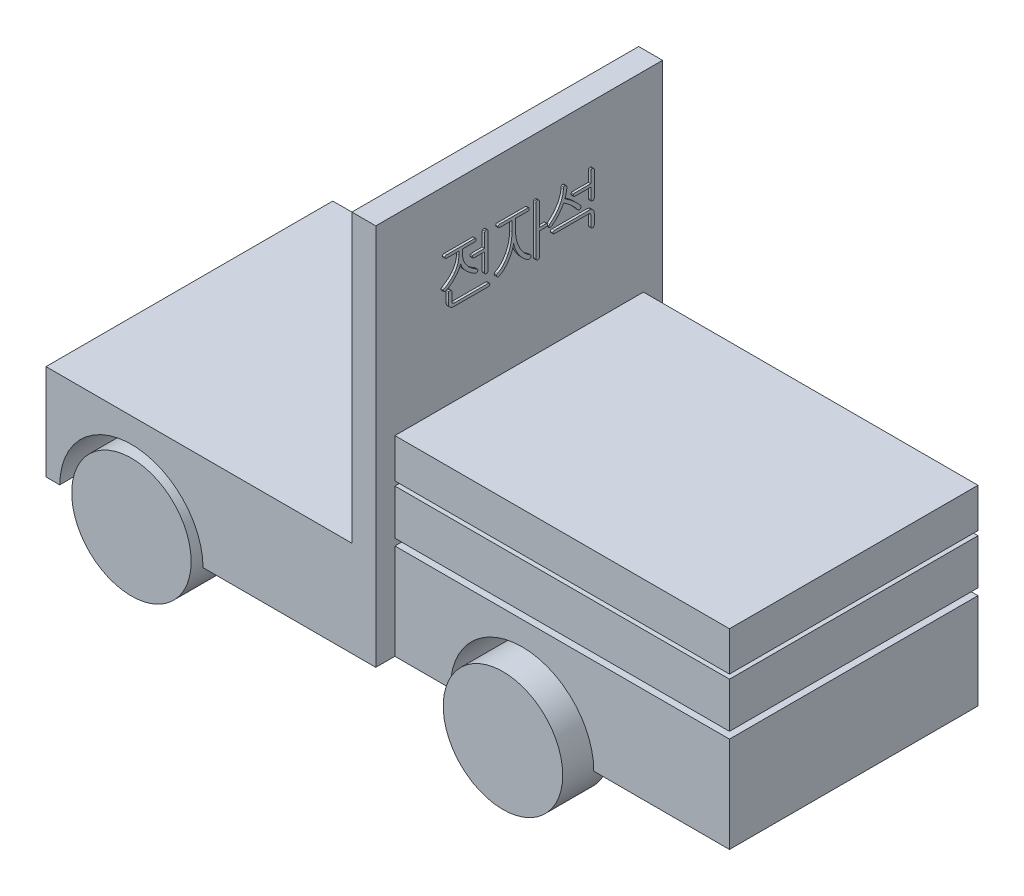
from build123d import *

# Parameters (mm, degrees)
SKETCH_1_W          = 278
SKETCH_1_H          = 120
EXTRUDE_1_DEPTH     = 1
SKETCH_2_W          = 140
SKETCH_2_H          = 8
CUT_EXTRUDE_1_DEPTH = 1
EXTRUDE_2_DEPTH     = 1
EXTRUDE_3_DEPTH     = 79
SKETCH_6_R          = 30
CUT_EXTRUDE_4_DEPTH = 200.904977427
SKETCH_7_W          = 138
SKETCH_7_H          = 40
CUT_EXTRUDE_5_DEPTH = 200.904977427
SKETCH_8_W          = 140
SKETCH_8_H          = 2.813625553
SKETCH_8_H_2        = 1.841613288
CUT_EXTRUDE_6_DEPTH = 196.20758182
SKETCH_10_R         = 25
EXTRUDE_4_DEPTH     = 20
EXTRUDE_4_2_DEPTH   = 20
SKETCH_11_R         = 25
EXTRUDE_5_DEPTH     = 20
SKETCH_12_R         = 25
EXTRUDE_6_DEPTH     = 20
SKETCH_13_R         = 3
EXTRUDE_7_DEPTH     = 80
SKETCH_14_R         = 3
EXTRUDE_8_DEPTH     = 80
SKETCH_15_W         = 10
SKETCH_15_H         = 120
EXTRUDE_10_DEPTH    = 120
EXTRUDE_11_DEPTH    = 1
EXTRUDE_12_DEPTH    = 1


with BuildPart() as part:
    # 스케치1 → 보스-돌출1 (new body)
    with BuildSketch(Plane(origin=(0, 0, 0), x_dir=(1, 0, 0), z_dir=(0, 1, 0))):
        Rectangle(SKETCH_1_W, SKETCH_1_H)
    extrude(amount=EXTRUDE_1_DEPTH)

    # 스케치2 → 컷-돌출1 (cut)
    with BuildSketch(Plane.XZ):
        with Locations((69, 56)):
            Rectangle(SKETCH_2_W, SKETCH_2_H)
        with Locations((69, -56)):
            Rectangle(SKETCH_2_W, SKETCH_2_H)
    extrude(amount=-CUT_EXTRUDE_1_DEPTH, mode=Mode.SUBTRACT)

    # 스케치4 → 보스-돌출2 (add)
    with BuildSketch(Plane.XZ):
        Polygon((-139, 60), (-139, -60), (-1, -60), (-1, -52), (139, -52), (139, 52), (-1, 52), (-1, 60), align=None)
    extrude(amount=EXTRUDE_2_DEPTH)

    # 스케치4<2> → 보스-돌출3 (add)
    with BuildSketch(Plane.XZ):
        Polygon((-139, 60), (-139, -60), (-1, -60), (-1, -52), (139, -52), (139, 52), (-1, 52), (-1, 60), align=None)
    extrude(amount=EXTRUDE_3_DEPTH)

    # 스케치6 → 컷-돌출4 (cut, through all)
    with BuildSketch(Plane(origin=(0, 0, -60), x_dir=(-1, 0, 0), z_dir=(0, 0, -1))):
        with Locations((103.25977482, -79.299624836)):
            Circle(SKETCH_6_R)
        with Locations((-52.217805509, -78.918205393)):
            Circle(SKETCH_6_R)
    extrude(amount=-CUT_EXTRUDE_4_DEPTH, mode=Mode.SUBTRACT)

    # 스케치7 → 컷-돌출5 (cut, through all)
    with BuildSketch(Plane(origin=(0, 0, -60), x_dir=(-1, 0, 0), z_dir=(0, 0, -1))):
        with Locations((70, -19)):
            Rectangle(SKETCH_7_W, SKETCH_7_H)
    extrude(amount=-CUT_EXTRUDE_5_DEPTH, mode=Mode.SUBTRACT)

    # 스케치8 → 컷-돌출6 (cut, through all)
    with BuildSketch(Plane(origin=(0, 0, -52), x_dir=(-1, 0, 0), z_dir=(0, 0, -1))):
        with Locations((-69, -37.593187224)):
            Rectangle(SKETCH_8_W, SKETCH_8_H)
        with Locations((-69, -16.358338052)):
            Rectangle(SKETCH_8_W, SKETCH_8_H_2)
    extrude(amount=-CUT_EXTRUDE_6_DEPTH, mode=Mode.SUBTRACT)


with BuildPart() as cut_extrude_6_piece_1:
    # of the separate pieces the step leaves, piece 1, a body of its own (cut_extrude_6_pieces)
    add(part.part.solids().sort_by_distance((-139, -79, -60))[0])



with BuildPart() as cut_extrude_6_piece_2:
    # of the separate pieces the step leaves, piece 2, a body of its own (cut_extrude_6_pieces)
    add(part.part.solids().sort_by_distance((-1, -17.279144696, -52))[0])


with BuildPart() as cut_extrude_6_piece_3:
    # of the separate pieces the step leaves, piece 3, a body of its own (cut_extrude_6_pieces)
    add(part.part.solids().sort_by_distance((-1, 1, -52))[0])


with BuildPart() as body_4:
    # 스케치10 → 보스-돌출4 (new body)
    with BuildSketch(Plane(origin=(0, 0, -60), x_dir=(-1, 0, 0), z_dir=(0, 0, -1))):
        with Locations((103.25977482, -79.299624836)):
            Circle(SKETCH_10_R)
    extrude(amount=-EXTRUDE_4_DEPTH)



with BuildPart() as body_5:
    # 스케치10 → Extrude 4 2 (new body)
    with BuildSketch(Plane(origin=(0, 0, -60), x_dir=(-1, 0, 0), z_dir=(0, 0, -1))):
        with Locations((-52.217805509, -78.918205393)):
            Circle(SKETCH_10_R)
    extrude(amount=-EXTRUDE_4_2_DEPTH)



with BuildPart() as body_6:
    # 스케치11 → 보스-돌출5 (new body)
    with BuildSketch(Plane.XY.offset(60)):
        with Locations((-103.25977482, -79.299624836)):
            Circle(SKETCH_11_R)
    extrude(amount=-EXTRUDE_5_DEPTH)


with BuildPart() as body_7:
    # 스케치12 → 보스-돌출6 (new body)
    with BuildSketch(Plane.XY.offset(60)):
        with Locations((52.217805509, -78.918205393)):
            Circle(SKETCH_12_R)
    extrude(amount=-EXTRUDE_6_DEPTH)


with BuildPart() as body_5_1:
    add(body_5.part)

    add(body_7.part)  # 보스-돌출7 merges body 7
    # 스케치13 → 보스-돌출7 (add)
    with BuildSketch(Plane.XY.offset(-40)):
        with Locations((52.217805509, -78.918205393)):
            Circle(SKETCH_13_R)
    extrude(amount=EXTRUDE_7_DEPTH)


with BuildPart() as body_4_1:
    add(body_4.part)

    add(body_6.part)  # 보스-돌출8 merges body 6
    # 스케치14 → 보스-돌출8 (add)
    with BuildSketch(Plane.XY.offset(-40)):
        with Locations((-103.25977482, -79.299624836)):
            Circle(SKETCH_14_R)
    extrude(amount=EXTRUDE_8_DEPTH)


with BuildPart() as cut_extrude_6_piece_1_1:
    add(cut_extrude_6_piece_1.part)

    add(cut_extrude_6_piece_2.part)  # 보스-돌출10 merges 컷-돌출6 piece 2

    add(cut_extrude_6_piece_3.part)  # 보스-돌출10 merges 컷-돌출6 piece 3
    # 스케치15 → 보스-돌출10 (add)
    with BuildSketch(Plane(origin=(0, -39, 0), x_dir=(1, 0, 0), z_dir=(0, 1, 0))):
        with Locations((-6, 0)):
            Rectangle(SKETCH_15_W, SKETCH_15_H)
    extrude(amount=EXTRUDE_10_DEPTH)

    # 스케치16 → 보스-돌출11 (add)
    with BuildSketch(Plane(origin=(-1, 0, 0), x_dir=(0, 0, -1), z_dir=(1, 0, 0))):
        with BuildLine():
            Line((-19.663005231, 56.697460227), (-31.305943932, 56.697460227))
            add(Edge.make_bspline(
                [(-31.305943932, 56.697460227), (-31.362088951, 56.696857508), (-31.468982679, 56.69571), (-31.616755078, 56.664380158), (-31.743741736, 56.618551235), (-31.849600427, 56.555059778), (-31.928456236, 56.465808964), (-31.987087827, 56.360819875), (-32.021597964, 56.235241072), (-32.025257343, 56.145615453), (-32.027187923, 56.098331621)],
                knots=[0, 0, 0, 0, 1.254312376, 2.388068055, 3.361322203, 4.269934754, 5.116637512, 5.996224973, 6.942867436, 8, 8, 8, 8], degree=3))
            add(Edge.make_bspline(
                [(-32.027187923, 56.098331621), (-32.026034474, 56.049929195), (-32.023858473, 55.958617217), (-31.999411425, 55.828483689), (-31.944047265, 55.718669358), (-31.865460214, 55.627870242), (-31.76265965, 55.558379909), (-31.638101997, 55.507980391), (-31.48998565, 55.484064984), (-31.384868948, 55.479003962), (-31.328840567, 55.476306381)],
                knots=[0, 0, 0, 0, 1.077689366, 2.03307883, 2.919667863, 3.782879275, 4.678469442, 5.656673677, 6.750980786, 8, 8, 8, 8], degree=3))
            Line((-31.328840567, 55.476306381), (-26.230523259, 55.476306381))
            Line((-26.230523259, 55.476306381), (-26.230523259, 54.037634506))
            add(Edge.make_bspline(
                [(-26.230523259, 54.037634506), (-26.236479626, 53.780422336), (-26.248250535, 53.27212233), (-26.339300195, 52.520593704), (-26.48285695, 51.788755373), (-26.689545135, 51.076056735), (-26.959552956, 50.38486207), (-27.279182819, 49.710319701), (-27.661829298, 49.057242072), (-27.960736984, 48.646883064), (-28.111863404, 48.439407343)],
                knots=[0, 0, 0, 0, 1.026226658, 2.028018415, 3.016604275, 3.999792593, 4.984931618, 5.974911074, 6.97612389, 8, 8, 8, 8], degree=3))
            add(Edge.make_bspline(
                [(-28.111863404, 48.439407343), (-28.244634179, 48.269780379), (-28.510665882, 47.929900237), (-28.950749647, 47.447031752), (-29.421839497, 46.983000292), (-29.928302744, 46.53921606), (-30.465742625, 46.114267197), (-31.041600001, 45.716439263), (-31.64316414, 45.32563732), (-32.06759651, 45.092586037), (-32.282867009, 44.974383304)],
                knots=[0, 0, 0, 0, 0.945793955, 1.895079516, 2.866915337, 3.848656695, 4.851192434, 5.874115176, 6.921759228, 8, 8, 8, 8], degree=3))
            add(Edge.make_bspline(
                [(-32.282867009, 44.974383304), (-32.334821824, 44.945475298), (-32.431839699, 44.891493904), (-32.554858633, 44.789772297), (-32.647243108, 44.674861821), (-32.67936962, 44.586278948), (-32.695006432, 44.543163352)],
                knots=[0, 0, 0, 0, 1.160702542, 2.167439078, 3.108044775, 4, 4, 4, 4], degree=3))
            add(Edge.make_bspline(
                [(-32.695006432, 44.543163352), (-32.710216758, 44.461669066), (-32.741516477, 44.293970605), (-32.660387882, 44.143498978), (-32.618684317, 44.066150131)],
                knots=[0, 0, 0, 0, 0.971914529, 2, 2, 2, 2], degree=3))
            add(Edge.make_bspline(
                [(-32.618684317, 44.066150131), (-32.562620968, 43.993359182), (-32.453413755, 43.851567852), (-32.287354738, 43.785419465), (-32.206544894, 43.753229458)],
                knots=[0, 0, 0, 0, 1.026733438, 2, 2, 2, 2], degree=3))
            add(Edge.make_bspline(
                [(-32.206544894, 43.753229458), (-32.154744398, 43.739193975), (-32.053582106, 43.71178378), (-31.894773616, 43.715091861), (-31.736561172, 43.743018216), (-31.638392818, 43.790218989), (-31.588335759, 43.81428715)],
                knots=[0, 0, 0, 0, 1.004142803, 1.961011879, 2.960298892, 4, 4, 4, 4], degree=3))
            add(Edge.make_bspline(
                [(-31.588335759, 43.81428715), (-31.229233766, 44.01227928), (-30.514131965, 44.406553138), (-29.515821258, 45.119894062), (-28.573768018, 45.910658269), (-28.007266877, 46.506649907), (-27.722620615, 46.806114073)],
                knots=[0, 0, 0, 0, 1.000831047, 1.993016186, 2.991563478, 4, 4, 4, 4], degree=3))
            add(Edge.make_bspline(
                [(-27.722620615, 46.806114073), (-27.587465763, 46.956117141), (-27.322633311, 47.250044288), (-26.959099511, 47.706772274), (-26.629441071, 48.166680881), (-26.332508526, 48.627590297), (-26.074603874, 49.095236258), (-25.849559748, 49.563689955), (-25.65605401, 50.035546294), (-25.557781154, 50.356810945), (-25.509279269, 50.515368881)],
                knots=[0, 0, 0, 0, 1.111612807, 2.178176653, 3.212276185, 4.226543536, 5.195337507, 6.150873671, 7.087376547, 8, 8, 8, 8], degree=3))
            add(Edge.make_bspline(
                [(-25.509279269, 50.515368881), (-25.468532829, 50.37080963), (-25.385466795, 50.07610993), (-25.210438693, 49.64036146), (-24.995715841, 49.203413315), (-24.746845223, 48.7611303), (-24.455163278, 48.318247655), (-24.122988606, 47.8730875), (-23.751705574, 47.42525835), (-23.483036227, 47.134343761), (-23.345547298, 46.985471045)],
                knots=[0, 0, 0, 0, 0.861091005, 1.755427336, 2.688802784, 3.652740929, 4.664701696, 5.728630709, 6.837648821, 8, 8, 8, 8], degree=3))
            add(Edge.make_bspline(
                [(-23.345547298, 46.985471045), (-23.06524231, 46.704388259), (-22.505297395, 46.142889592), (-21.580795078, 45.390185243), (-20.605393954, 44.695578235), (-19.909599072, 44.299513119), (-19.559970375, 44.100495083)],
                knots=[0, 0, 0, 0, 0.996375412, 1.990386795, 2.990193136, 4, 4, 4, 4], degree=3))
            add(Edge.make_bspline(
                [(-19.559970375, 44.100495083), (-19.501466559, 44.066938386), (-19.389187478, 44.0025372), (-19.202806311, 43.956924243), (-19.016809917, 43.950368525), (-18.898104713, 43.981758458), (-18.838726384, 43.997460227)],
                knots=[0, 0, 0, 0, 1.069670952, 2.052886111, 3.026021054, 4, 4, 4, 4], degree=3))
            add(Edge.make_bspline(
                [(-18.838726384, 43.997460227), (-18.748977677, 44.027558496), (-18.56707103, 44.088562998), (-18.440899088, 44.23325873), (-18.376977586, 44.306564795)],
                knots=[0, 0, 0, 0, 0.986755668, 2, 2, 2, 2], degree=3))
            add(Edge.make_bspline(
                [(-18.376977586, 44.306564795), (-18.353310199, 44.343748735), (-18.306826758, 44.416779082), (-18.27318373, 44.54098676), (-18.268922898, 44.669078431), (-18.287302797, 44.752001164), (-18.296839365, 44.795026333)],
                knots=[0, 0, 0, 0, 1.02728291, 2.017613685, 2.971421923, 4, 4, 4, 4], degree=3))
            add(Edge.make_bspline(
                [(-18.296839365, 44.795026333), (-18.314259767, 44.837829116), (-18.349558564, 44.924559993), (-18.436599316, 45.044098058), (-18.561490582, 45.141400285), (-18.658483035, 45.192178276), (-18.708978788, 45.218614073)],
                knots=[0, 0, 0, 0, 0.909299773, 1.842505606, 2.876775447, 4, 4, 4, 4], degree=3))
            add(Edge.make_bspline(
                [(-18.708978788, 45.218614073), (-18.925292249, 45.341058688), (-19.350772998, 45.581902813), (-19.955426405, 45.975067276), (-20.531345137, 46.368743895), (-21.063341239, 46.782566254), (-21.56367885, 47.201238618), (-22.020557984, 47.638771926), (-22.447207957, 48.082655581), (-22.703842337, 48.395721028), (-22.830373019, 48.55007441)],
                knots=[0, 0, 0, 0, 1.118299456, 2.199654551, 3.244499642, 4.256656335, 5.231476444, 6.178954279, 7.102153982, 8, 8, 8, 8], degree=3))
            add(Edge.make_bspline(
                [(-22.830373019, 48.55007441), (-22.985495619, 48.752246839), (-23.292644779, 49.152556605), (-23.683581674, 49.793402841), (-24.020522084, 50.452926711), (-24.28884281, 51.137958824), (-24.506536343, 51.841103975), (-24.65264321, 52.568777846), (-24.748265627, 53.316380439), (-24.759479654, 53.823633853), (-24.765138644, 54.07961167)],
                knots=[0, 0, 0, 0, 1.02297369, 2.025530189, 3.010417894, 3.994364081, 4.977115498, 5.963182147, 6.972150463, 8, 8, 8, 8], degree=3))
            Line((-24.765138644, 54.07961167), (-24.765138644, 55.476306381))
            Line((-24.765138644, 55.476306381), (-19.663005231, 55.476306381))
            add(Edge.make_bspline(
                [(-19.663005231, 55.476306381), (-19.56727103, 55.481113896), (-19.392818401, 55.489874439), (-19.164831177, 55.615878279), (-19.036360777, 55.837859589), (-19.024540239, 56.006314406), (-19.018083356, 56.098331621)],
                knots=[0, 0, 0, 0, 1.116172225, 2.033956271, 2.926062941, 4, 4, 4, 4], degree=3))
            add(Edge.make_bspline(
                [(-19.018083356, 56.098331621), (-19.024467255, 56.1878503), (-19.036148837, 56.351656117), (-19.165892686, 56.567006048), (-19.395110385, 56.681836393), (-19.567637357, 56.691898299), (-19.663005231, 56.697460227)],
                knots=[0, 0, 0, 0, 1.062916276, 1.944978096, 2.864043889, 4, 4, 4, 4], degree=3))
        make_face()
        with BuildLine():
            Line((-14.018984798, 42.387063593), (-14.018984798, 56.727989073))
            add(Edge.make_bspline(
                [(-14.018984798, 56.727989073), (-14.021642053, 56.781783753), (-14.026749175, 56.885174675), (-14.073374248, 57.02965186), (-14.151978833, 57.15414267), (-14.225705297, 57.215673856), (-14.263215567, 57.246979458)],
                knots=[0, 0, 0, 0, 1.08048682, 2.076646448, 3.021443512, 4, 4, 4, 4], degree=3))
            add(Edge.make_bspline(
                [(-14.263215567, 57.246979458), (-14.332807996, 57.30038892), (-14.476731333, 57.41084444), (-14.658038749, 57.423576772), (-14.751677106, 57.430152535)],
                knots=[0, 0, 0, 0, 0.967076375, 2, 2, 2, 2], degree=3))
            add(Edge.make_bspline(
                [(-14.751677106, 57.430152535), (-14.850463928, 57.424066127), (-15.039143853, 57.412441267), (-15.190787455, 57.30037255), (-15.263035279, 57.246979458)],
                knots=[0, 0, 0, 0, 1.047136548, 2, 2, 2, 2], degree=3))
            add(Edge.make_bspline(
                [(-15.263035279, 57.246979458), (-15.296608219, 57.210118754), (-15.363255053, 57.136945265), (-15.432838432, 57.002114325), (-15.47515553, 56.852650254), (-15.481257092, 56.747354171), (-15.484369413, 56.693644121)],
                knots=[0, 0, 0, 0, 0.97485754, 1.935224236, 2.946786943, 4, 4, 4, 4], degree=3))
            Line((-15.484369413, 56.693644121), (-15.484369413, 51.080152535))
            Line((-15.484369413, 51.080152535), (-19.891971577, 51.080152535))
            add(Edge.make_bspline(
                [(-19.891971577, 51.080152535), (-19.94812358, 51.077955132), (-20.053718731, 51.073822865), (-20.202182788, 51.043308879), (-20.332036522, 50.992078567), (-20.400657763, 50.93570355), (-20.433858596, 50.908427775)],
                knots=[0, 0, 0, 0, 1.157668864, 2.177023309, 3.117994037, 4, 4, 4, 4], degree=3))
            add(Edge.make_bspline(
                [(-20.433858596, 50.908427775), (-20.485692385, 50.846588955), (-20.592092335, 50.719651535), (-20.606054969, 50.554349251), (-20.613215567, 50.469575612)],
                knots=[0, 0, 0, 0, 0.974319798, 2, 2, 2, 2], degree=3))
            add(Edge.make_bspline(
                [(-20.613215567, 50.469575612), (-20.595510102, 50.390951719), (-20.559152129, 50.229498436), (-20.441031711, 50.11325549), (-20.380433115, 50.053620083)],
                knots=[0, 0, 0, 0, 0.973952238, 2, 2, 2, 2], degree=3))
            add(Edge.make_bspline(
                [(-20.380433115, 50.053620083), (-20.339482881, 50.023846145), (-20.25596139, 49.963119661), (-20.107047302, 49.903765305), (-19.941179617, 49.863590773), (-19.823553255, 49.860572426), (-19.762223981, 49.858998689)],
                knots=[0, 0, 0, 0, 0.916313001, 1.86889846, 2.888863783, 4, 4, 4, 4], degree=3))
            Line((-19.762223981, 49.858998689), (-15.484369413, 49.858998689))
            Line((-15.484369413, 49.858998689), (-15.484369413, 42.387063593))
            add(Edge.make_bspline(
                [(-15.484369413, 42.387063593), (-15.481303516, 42.325755128), (-15.475350724, 42.206717722), (-15.433567863, 42.038271417), (-15.363771037, 41.887252672), (-15.296654839, 41.803283652), (-15.263035279, 41.761222246)],
                knots=[0, 0, 0, 0, 1.083790757, 2.104303887, 3.050415952, 4, 4, 4, 4], degree=3))
            add(Edge.make_bspline(
                [(-15.263035279, 41.761222246), (-15.228890682, 41.7285982), (-15.162446436, 41.665112893), (-15.035648566, 41.604614381), (-14.899874692, 41.559105564), (-14.80170391, 41.556486952), (-14.751677106, 41.555152535)],
                knots=[0, 0, 0, 0, 0.993204585, 1.932743019, 2.946547454, 4, 4, 4, 4], degree=3))
            add(Edge.make_bspline(
                [(-14.751677106, 41.555152535), (-14.704155759, 41.556448915), (-14.610887734, 41.558993263), (-14.481823692, 41.605431591), (-14.359776911, 41.665266682), (-14.296046361, 41.728597417), (-14.263215567, 41.761222246)],
                knots=[0, 0, 0, 0, 1.038496957, 2.038211635, 2.989384685, 4, 4, 4, 4], degree=3))
            add(Edge.make_bspline(
                [(-14.263215567, 41.761222246), (-14.2256459, 41.803042112), (-14.151447919, 41.885633998), (-14.073176465, 42.037022154), (-14.02721954, 42.206263), (-14.021779206, 42.325710037), (-14.018984798, 42.387063593)],
                knots=[0, 0, 0, 0, 0.974668584, 1.924915702, 2.934140169, 4, 4, 4, 4], degree=3))
        make_face()
        with BuildLine():
            add(Edge.make_bspline(
                [(-29.16129249, 42.150465035), (-29.164014287, 42.216906523), (-29.16926761, 42.345144795), (-29.215049784, 42.52558403), (-29.291500283, 42.684951851), (-29.367709035, 42.768964749), (-29.405523259, 42.810651333)],
                knots=[0, 0, 0, 0, 1.101285562, 2.125583874, 3.069928453, 4, 4, 4, 4], degree=3))
            add(Edge.make_bspline(
                [(-29.405523259, 42.810651333), (-29.43855965, 42.842906104), (-29.503129982, 42.905948746), (-29.622967162, 42.971107435), (-29.753349829, 43.016415632), (-29.846515568, 43.019145994), (-29.893984798, 43.02053715)],
                knots=[0, 0, 0, 0, 1.007220755, 1.968634524, 2.964991255, 4, 4, 4, 4], degree=3))
            add(Edge.make_bspline(
                [(-29.893984798, 43.02053715), (-29.94383564, 43.018685322), (-30.041304301, 43.015064617), (-30.179782509, 42.976828587), (-30.303639658, 42.909588877), (-30.370968719, 42.846617112), (-30.405342971, 42.814467439)],
                knots=[0, 0, 0, 0, 1.052107783, 2.05708734, 3.008063269, 4, 4, 4, 4], degree=3))
            add(Edge.make_bspline(
                [(-30.405342971, 42.814467439), (-30.439315244, 42.773873667), (-30.509280823, 42.690271174), (-30.574618024, 42.534079519), (-30.618869942, 42.357721016), (-30.623974019, 42.232203002), (-30.626677106, 42.165729458)],
                knots=[0, 0, 0, 0, 0.901271959, 1.856161166, 2.864636567, 4, 4, 4, 4], degree=3))
            Line((-30.626677106, 42.165729458), (-30.626677106, 38.72741816))
            add(Edge.make_bspline(
                [(-30.626677106, 38.72741816), (-30.624584891, 38.635723194), (-30.620501191, 38.456747945), (-30.585598377, 38.195948304), (-30.528869385, 37.953305561), (-30.452345329, 37.725625643), (-30.348813786, 37.517927247), (-30.225852112, 37.322824644), (-30.077254576, 37.147651463), (-29.962654275, 37.045774434), (-29.905433115, 36.994906141)],
                knots=[0, 0, 0, 0, 1.1330055, 2.211462096, 3.244972826, 4.20957373, 5.17289243, 6.106234425, 7.05442254, 8, 8, 8, 8], degree=3))
            add(Edge.make_bspline(
                [(-29.905433115, 36.994906141), (-29.786453791, 36.906870657), (-29.542823436, 36.726603064), (-29.104670182, 36.551807334), (-28.610937889, 36.441863833), (-28.261369578, 36.431668493), (-28.077518452, 36.426306381)],
                knots=[0, 0, 0, 0, 0.906225781, 1.855651067, 2.872206223, 4, 4, 4, 4], degree=3))
            Line((-28.077518452, 36.426306381), (-13.931214365, 36.426306381))
            add(Edge.make_bspline(
                [(-13.931214365, 36.426306381), (-13.835480164, 36.431113896), (-13.661027536, 36.439874439), (-13.433040311, 36.565878279), (-13.304569912, 36.787859589), (-13.292749373, 36.956314406), (-13.28629249, 37.048331621)],
                knots=[0, 0, 0, 0, 1.116172225, 2.033956271, 2.926062941, 4, 4, 4, 4], degree=3))
            add(Edge.make_bspline(
                [(-13.28629249, 37.048331621), (-13.292694819, 37.137810014), (-13.304410126, 37.301542114), (-13.434535833, 37.518387262), (-13.666440331, 37.630926164), (-13.839814148, 37.641598833), (-13.935030471, 37.647460227)],
                knots=[0, 0, 0, 0, 1.059374276, 1.938496766, 2.867829282, 4, 4, 4, 4], degree=3))
            Line((-13.935030471, 37.647460227), (-27.890529269, 37.647460227))
            add(Edge.make_bspline(
                [(-27.890529269, 37.647460227), (-28.005328195, 37.649649566), (-28.216914132, 37.653684737), (-28.501872611, 37.69960376), (-28.734613325, 37.763574286), (-28.849914965, 37.846668736), (-28.901797298, 37.884058785)],
                knots=[0, 0, 0, 0, 1.300896085, 2.397681981, 3.279004213, 4, 4, 4, 4], degree=3))
            add(Edge.make_bspline(
                [(-28.901797298, 37.884058785), (-28.943148057, 37.935662958), (-29.032414296, 38.047063826), (-29.106025286, 38.272589795), (-29.156071651, 38.54565598), (-29.15945313, 38.747417377), (-29.16129249, 38.857165756)],
                knots=[0, 0, 0, 0, 0.765515088, 1.652561032, 2.723107459, 4, 4, 4, 4], degree=3))
            Line((-29.16129249, 38.857165756), (-29.16129249, 42.150465035))
        make_face()
        with BuildLine():
            Line((2.561994769, 56.697460227), (-9.080943932, 56.697460227))
            add(Edge.make_bspline(
                [(-9.080943932, 56.697460227), (-9.137088951, 56.696857508), (-9.243982679, 56.69571), (-9.391755078, 56.664380158), (-9.518741736, 56.618551235), (-9.624600427, 56.555059778), (-9.703456236, 56.465808964), (-9.762087827, 56.360819875), (-9.796597964, 56.235241072), (-9.800257343, 56.145615453), (-9.802187923, 56.098331621)],
                knots=[0, 0, 0, 0, 1.254312376, 2.388068055, 3.361322203, 4.269934754, 5.116637512, 5.996224973, 6.942867436, 8, 8, 8, 8], degree=3))
            add(Edge.make_bspline(
                [(-9.802187923, 56.098331621), (-9.801034474, 56.049929195), (-9.798858473, 55.958617217), (-9.774411425, 55.828483689), (-9.719047265, 55.718669358), (-9.640460214, 55.627870242), (-9.53765965, 55.558379909), (-9.413101997, 55.507980391), (-9.26498565, 55.484064984), (-9.159868948, 55.479003962), (-9.103840567, 55.476306381)],
                knots=[0, 0, 0, 0, 1.077689366, 2.03307883, 2.919667863, 3.782879275, 4.678469442, 5.656673677, 6.750980786, 8, 8, 8, 8], degree=3))
            Line((-9.103840567, 55.476306381), (-4.005523259, 55.476306381))
            Line((-4.005523259, 55.476306381), (-4.005523259, 51.278590035))
            add(Edge.make_bspline(
                [(-4.005523259, 51.278590035), (-4.010703633, 50.947717013), (-4.02098011, 50.291353302), (-4.101666892, 49.317462759), (-4.24113101, 48.366410858), (-4.425596058, 47.435035597), (-4.67243463, 46.527613203), (-4.964705425, 45.639183176), (-5.316016636, 44.773646067), (-5.592067708, 44.215901031), (-5.730403067, 43.936402535)],
                knots=[0, 0, 0, 0, 1.042748617, 2.068534776, 3.077184782, 4.071009686, 5.059076529, 6.039082652, 7.017340514, 8, 8, 8, 8], degree=3))
            add(Edge.make_bspline(
                [(-5.730403067, 43.936402535), (-5.86923953, 43.673561594), (-6.141133813, 43.158819661), (-6.601962936, 42.437655096), (-7.087088906, 41.773240765), (-7.603522814, 41.167125128), (-8.15139699, 40.620745165), (-8.732113651, 40.138925823), (-9.336162943, 39.707576028), (-9.76659116, 39.471269716), (-9.981544894, 39.353259506)],
                knots=[0, 0, 0, 0, 1.122245373, 2.197780724, 3.228801373, 4.22719408, 5.202148609, 6.146951505, 7.0745967, 8, 8, 8, 8], degree=3))
            add(Edge.make_bspline(
                [(-9.981544894, 39.353259506), (-10.033633777, 39.325875136), (-10.134579582, 39.272805515), (-10.26235918, 39.164300621), (-10.36247557, 39.036096038), (-10.401054453, 38.937252553), (-10.420397057, 38.887694602)],
                knots=[0, 0, 0, 0, 1.070254337, 2.07410256, 3.034397354, 4, 4, 4, 4], degree=3))
            add(Edge.make_bspline(
                [(-10.420397057, 38.887694602), (-10.435902796, 38.792319862), (-10.467806117, 38.596084718), (-10.383559621, 38.415650194), (-10.340258836, 38.322910948)],
                knots=[0, 0, 0, 0, 0.972045451, 2, 2, 2, 2], degree=3))
            add(Edge.make_bspline(
                [(-10.340258836, 38.322910948), (-10.292852457, 38.242698824), (-10.199342603, 38.084479106), (-10.035575026, 38.001360931), (-9.954832154, 37.9603809)],
                knots=[0, 0, 0, 0, 1.013933352, 2, 2, 2, 2], degree=3))
            add(Edge.make_bspline(
                [(-9.954832154, 37.9603809), (-9.908352677, 37.942670671), (-9.815133332, 37.907150994), (-9.664118442, 37.898108137), (-9.509273776, 37.920011133), (-9.413384544, 37.964087997), (-9.363335759, 37.987093641)],
                knots=[0, 0, 0, 0, 0.969085098, 1.943599286, 2.926674525, 4, 4, 4, 4], degree=3))
            add(Edge.make_bspline(
                [(-9.363335759, 37.987093641), (-9.183562675, 38.082144166), (-8.820916623, 38.273884204), (-8.30165508, 38.61864851), (-7.793036156, 39.003343435), (-7.300261704, 39.437708345), (-6.818865762, 39.914659267), (-6.353411034, 40.439238367), (-5.901664492, 41.009184736), (-5.618929507, 41.413705472), (-5.474723981, 41.620026333)],
                knots=[0, 0, 0, 0, 0.906760659, 1.829156883, 2.776920483, 3.750167946, 4.757419482, 5.798508009, 6.877155893, 8, 8, 8, 8], degree=3))
            add(Edge.make_bspline(
                [(-5.474723981, 41.620026333), (-5.337617776, 41.827222941), (-5.065872552, 42.237887716), (-4.701129848, 42.874159329), (-4.367542388, 43.514664748), (-4.073182553, 44.162568482), (-3.821230333, 44.818478375), (-3.604109875, 45.479549343), (-3.417007954, 46.14567451), (-3.328390019, 46.596816568), (-3.284279269, 46.821378496)],
                knots=[0, 0, 0, 0, 1.048730697, 2.078589803, 3.094647191, 4.096928637, 5.081323724, 6.059561183, 7.034120907, 8, 8, 8, 8], degree=3))
            add(Edge.make_bspline(
                [(-3.284279269, 46.821378496), (-3.245297815, 46.601943588), (-3.167015953, 46.161278306), (-2.994098305, 45.507711882), (-2.790483187, 44.852434868), (-2.536107142, 44.201770033), (-2.245795134, 43.550331887), (-1.913269168, 42.90200499), (-1.538881623, 42.254828989), (-1.261332311, 41.833660966), (-1.120547298, 41.620026333)],
                knots=[0, 0, 0, 0, 0.941616311, 1.890937133, 2.855062719, 3.840538817, 4.841714615, 5.868448211, 6.918784762, 8, 8, 8, 8], degree=3))
            add(Edge.make_bspline(
                [(-1.120547298, 41.620026333), (-0.975139646, 41.414898498), (-0.690003061, 41.012653843), (-0.234503559, 40.448628059), (0.228288766, 39.928280096), (0.696672217, 39.448785857), (1.17938083, 39.01637792), (1.671011752, 38.627407687), (2.171111403, 38.279097143), (2.519637545, 38.08362115), (2.691742366, 37.987093641)],
                knots=[0, 0, 0, 0, 1.135271252, 2.226205881, 3.27191851, 4.279329222, 5.251584193, 6.196295802, 7.109317353, 8, 8, 8, 8], degree=3))
            add(Edge.make_bspline(
                [(2.691742366, 37.987093641), (2.754454353, 37.956905734), (2.873967456, 37.899375261), (3.06028157, 37.851031601), (3.241785239, 37.846485661), (3.356046094, 37.871562234), (3.412986356, 37.884058785)],
                knots=[0, 0, 0, 0, 1.115842717, 2.126512499, 3.066374309, 4, 4, 4, 4], degree=3))
            add(Edge.make_bspline(
                [(3.412986356, 37.884058785), (3.462425006, 37.898107378), (3.560013527, 37.925838342), (3.684782926, 38.009512009), (3.79520426, 38.112226633), (3.847434425, 38.197959908), (3.874735154, 38.242772727)],
                knots=[0, 0, 0, 0, 1.017991431, 2.009445625, 2.9595364, 4, 4, 4, 4], degree=3))
            add(Edge.make_bspline(
                [(3.874735154, 38.242772727), (3.909984359, 38.332239038), (3.982517032, 38.516334838), (3.946615071, 38.71120482), (3.928160635, 38.811372487)],
                knots=[0, 0, 0, 0, 0.97195385, 2, 2, 2, 2], degree=3))
            add(Edge.make_bspline(
                [(3.928160635, 38.811372487), (3.91068735, 38.860334465), (3.875532633, 38.958841669), (3.792135044, 39.09753541), (3.66315486, 39.206847079), (3.566386172, 39.268003891), (3.516021212, 39.299834025)],
                knots=[0, 0, 0, 0, 0.948693112, 1.908687314, 2.911539665, 4, 4, 4, 4], degree=3))
            add(Edge.make_bspline(
                [(3.516021212, 39.299834025), (3.293523593, 39.429596196), (2.848248739, 39.689283613), (2.221660973, 40.149214716), (1.62610225, 40.656830141), (1.06098837, 41.216042066), (0.536544957, 41.833749064), (0.037224184, 42.499246494), (-0.424532368, 43.220709931), (-0.698963933, 43.731006087), (-0.838155471, 43.989828016)],
                knots=[0, 0, 0, 0, 0.951317492, 1.903830523, 2.867506828, 3.84144743, 4.838262553, 5.859291082, 6.914233618, 8, 8, 8, 8], degree=3))
            add(Edge.make_bspline(
                [(-0.838155471, 43.989828016), (-0.975845025, 44.266541574), (-1.250919173, 44.819355813), (-1.589845261, 45.683081571), (-1.886985553, 46.563105025), (-2.122049124, 47.469257393), (-2.309824468, 48.395196778), (-2.442789298, 49.345822238), (-2.525022344, 50.318011741), (-2.535072406, 50.974411554), (-2.540138644, 51.305302775)],
                knots=[0, 0, 0, 0, 0.977831147, 1.953496553, 2.933844218, 3.916256557, 4.914302049, 5.922680545, 6.952823026, 8, 8, 8, 8], degree=3))
            Line((-2.540138644, 51.305302775), (-2.540138644, 55.476306381))
            Line((-2.540138644, 55.476306381), (2.561994769, 55.476306381))
            add(Edge.make_bspline(
                [(2.561994769, 55.476306381), (2.65772897, 55.481113896), (2.832181599, 55.489874439), (3.060168823, 55.615878279), (3.188639223, 55.837859589), (3.200459761, 56.006314406), (3.206916644, 56.098331621)],
                knots=[0, 0, 0, 0, 1.116172225, 2.033956271, 2.926062941, 4, 4, 4, 4], degree=3))
            add(Edge.make_bspline(
                [(3.206916644, 56.098331621), (3.200532745, 56.1878503), (3.188851163, 56.351656117), (3.059107314, 56.567006048), (2.829889615, 56.681836393), (2.657362643, 56.691898299), (2.561994769, 56.697460227)],
                knots=[0, 0, 0, 0, 1.062916276, 1.944978096, 2.864043889, 4, 4, 4, 4], degree=3))
        make_face()
        with BuildLine():
            Line((7.473322894, 47.172460227), (7.473322894, 56.724172968))
            add(Edge.make_bspline(
                [(7.473322894, 56.724172968), (7.470324821, 56.777843079), (7.464427138, 56.883420632), (7.420050504, 57.034578374), (7.334456728, 57.164615483), (7.262246583, 57.236756849), (7.225276019, 57.273692198)],
                knots=[0, 0, 0, 0, 1.034410499, 2.034848173, 2.993870315, 4, 4, 4, 4], degree=3))
            add(Edge.make_bspline(
                [(7.225276019, 57.273692198), (7.153654806, 57.31975725), (7.002869174, 57.416738963), (6.823403882, 57.425534673), (6.729182269, 57.430152535)],
                knots=[0, 0, 0, 0, 0.949973983, 2, 2, 2, 2], degree=3))
            add(Edge.make_bspline(
                [(6.729182269, 57.430152535), (6.636386579, 57.425128873), (6.457334101, 57.415435545), (6.305994769, 57.319775496), (6.233088519, 57.273692198)],
                knots=[0, 0, 0, 0, 1.036519474, 2, 2, 2, 2], degree=3))
            add(Edge.make_bspline(
                [(6.233088519, 57.273692198), (6.197863101, 57.238420068), (6.127844494, 57.16830861), (6.06059883, 57.033412798), (6.01655754, 56.885959758), (6.010872332, 56.781763329), (6.007938279, 56.727989073)],
                knots=[0, 0, 0, 0, 0.978797188, 1.94558414, 2.93974599, 4, 4, 4, 4], degree=3))
            Line((6.007938279, 56.727989073), (6.007938279, 36.552237871))
            add(Edge.make_bspline(
                [(6.007938279, 36.552237871), (6.010712886, 36.498419677), (6.016026036, 36.395362139), (6.061438874, 36.249608078), (6.127771441, 36.115713076), (6.19783865, 36.045615832), (6.233088519, 36.010350852)],
                knots=[0, 0, 0, 0, 1.066684578, 2.042615659, 3.015266289, 4, 4, 4, 4], degree=3))
            add(Edge.make_bspline(
                [(6.233088519, 36.010350852), (6.267215007, 35.977670287), (6.333624013, 35.914074997), (6.458466061, 35.855428551), (6.588338322, 35.807994245), (6.681642502, 35.805534443), (6.729182269, 35.804281141)],
                knots=[0, 0, 0, 0, 1.02000029, 1.984886568, 2.973271896, 4, 4, 4, 4], degree=3))
            add(Edge.make_bspline(
                [(6.729182269, 35.804281141), (6.776644466, 35.805753289), (6.871014538, 35.808680392), (7.001980237, 35.853561743), (7.125286607, 35.915435324), (7.191055974, 35.977867277), (7.225276019, 36.010350852)],
                knots=[0, 0, 0, 0, 1.026251178, 2.040516531, 2.98047351, 4, 4, 4, 4], degree=3))
            add(Edge.make_bspline(
                [(7.225276019, 36.010350852), (7.262610687, 36.045760347), (7.336956971, 36.116272945), (7.4169926, 36.247082748), (7.465756165, 36.39497941), (7.470733282, 36.498418257), (7.473322894, 36.552237871)],
                knots=[0, 0, 0, 0, 0.999281344, 1.989916087, 2.954145912, 4, 4, 4, 4], degree=3))
            Line((7.473322894, 36.552237871), (7.473322894, 45.951306381))
            Line((7.473322894, 45.951306381), (10.285792846, 45.951306381))
            add(Edge.make_bspline(
                [(10.285792846, 45.951306381), (10.37688264, 45.955755517), (10.542666064, 45.963852945), (10.754973026, 46.095655718), (10.878093139, 46.313330616), (10.887435301, 46.48130319), (10.892553664, 46.573331621)],
                knots=[0, 0, 0, 0, 1.089686211, 1.983228905, 2.895056032, 4, 4, 4, 4], degree=3))
            add(Edge.make_bspline(
                [(10.892553664, 46.573331621), (10.887499724, 46.662842324), (10.878281024, 46.826115406), (10.754151079, 47.037340851), (10.540230153, 47.157970366), (10.376493803, 47.16729493), (10.285792846, 47.172460227)],
                knots=[0, 0, 0, 0, 1.094414196, 1.99627948, 2.890048738, 4, 4, 4, 4], degree=3))
            Line((10.285792846, 47.172460227), (7.473322894, 47.172460227))
        make_face()
        with BuildLine():
            add(Edge.make_bspline(
                [(17.486784433, 56.193734266), (17.48350103, 55.998933892), (17.476918082, 55.60837538), (17.410720993, 55.019835096), (17.314293356, 54.426527432), (17.170544879, 53.827851759), (16.987887209, 53.226504787), (16.762569993, 52.62036806), (16.507476695, 52.006246767), (16.303871949, 51.60428038), (16.200756789, 51.40070542)],
                knots=[0, 0, 0, 0, 0.932753693, 1.870093409, 2.833740411, 3.810645943, 4.816813725, 5.842351641, 6.907263906, 8, 8, 8, 8], degree=3))
            add(Edge.make_bspline(
                [(16.200756789, 51.40070542), (16.070217474, 51.161060307), (15.807981737, 50.679645855), (15.357610357, 49.9865248), (14.868262461, 49.308138604), (14.333559721, 48.649035085), (13.756759973, 48.006892285), (13.135698727, 47.385145789), (12.477018318, 46.774927333), (12.007732812, 46.392748875), (11.770257991, 46.199353256)],
                knots=[0, 0, 0, 0, 0.951481483, 1.911396945, 2.880495871, 3.867864967, 4.870034642, 5.889611969, 6.932070106, 8, 8, 8, 8], degree=3))
            add(Edge.make_bspline(
                [(11.770257991, 46.199353256), (11.715219033, 46.156593424), (11.61235309, 46.076676749), (11.490270319, 45.936959445), (11.407361711, 45.788523811), (11.389660881, 45.682526256), (11.381015202, 45.630753496)],
                knots=[0, 0, 0, 0, 1.174969224, 2.19597762, 3.118854981, 4, 4, 4, 4], degree=3))
            add(Edge.make_bspline(
                [(11.381015202, 45.630753496), (11.376096849, 45.584905693), (11.366603145, 45.496407489), (11.391979276, 45.36556404), (11.444924891, 45.242471087), (11.505981974, 45.176381377), (11.537475539, 45.142291958)],
                knots=[0, 0, 0, 0, 1.031287673, 1.99065387, 2.963568715, 4, 4, 4, 4], degree=3))
            add(Edge.make_bspline(
                [(11.537475539, 45.142291958), (11.5676022, 45.109555034), (11.62652159, 45.045530694), (11.743658993, 44.987527997), (11.865782053, 44.939914095), (11.954192136, 44.937468119), (11.999224337, 44.936222246)],
                knots=[0, 0, 0, 0, 1.013742355, 1.982598731, 2.972424673, 4, 4, 4, 4], degree=3))
            add(Edge.make_bspline(
                [(11.999224337, 44.936222246), (12.055333104, 44.933922283), (12.165963165, 44.929387428), (12.331441485, 44.963224034), (12.492422207, 45.02426405), (12.592819568, 45.084688252), (12.644146212, 45.115579218)],
                knots=[0, 0, 0, 0, 0.984834864, 1.94180599, 2.947779218, 4, 4, 4, 4], degree=3))
            add(Edge.make_bspline(
                [(12.644146212, 45.115579218), (12.929197565, 45.341378081), (13.493881636, 45.788683523), (14.287723595, 46.509928033), (15.031639692, 47.258560307), (15.4840579, 47.790241268), (15.708479144, 48.05398066)],
                knots=[0, 0, 0, 0, 1.025478375, 2.031463088, 3.023510779, 4, 4, 4, 4], degree=3))
            add(Edge.make_bspline(
                [(15.708479144, 48.05398066), (15.890494069, 48.283503914), (16.254312609, 48.742283958), (16.752430633, 49.466439995), (17.216484449, 50.213204584), (17.493329569, 50.730057026), (17.631796452, 50.988565996)],
                knots=[0, 0, 0, 0, 0.999884817, 1.998608825, 2.998983985, 4, 4, 4, 4], degree=3))
            add(Edge.make_bspline(
                [(17.631796452, 50.988565996), (17.883816655, 50.822739214), (18.389859158, 50.489768289), (19.123242262, 49.952356171), (19.837315638, 49.381641459), (20.294518646, 48.978119362), (20.524404625, 48.77522465)],
                knots=[0, 0, 0, 0, 0.992726646, 1.993339699, 2.991032299, 4, 4, 4, 4], degree=3))
            add(Edge.make_bspline(
                [(20.524404625, 48.77522465), (20.782600027, 48.543824588), (21.30879261, 48.072239906), (22.064184745, 47.30185887), (22.817289682, 46.474137285), (23.29286645, 45.882669936), (23.535312077, 45.581144121)],
                knots=[0, 0, 0, 0, 0.946304128, 1.928532459, 2.943980698, 4, 4, 4, 4], degree=3))
            add(Edge.make_bspline(
                [(23.535312077, 45.581144121), (23.575204598, 45.533093895), (23.652036869, 45.440550031), (23.799687977, 45.3410224), (23.957619159, 45.266683291), (24.072562997, 45.252494166), (24.130624577, 45.245326814)],
                knots=[0, 0, 0, 0, 1.058550168, 2.038748389, 3.009312978, 4, 4, 4, 4], degree=3))
            add(Edge.make_bspline(
                [(24.130624577, 45.245326814), (24.180367145, 45.243100738), (24.278391873, 45.238713941), (24.422033257, 45.270796778), (24.554764188, 45.332665167), (24.630379597, 45.39373728), (24.668695491, 45.424683785)],
                knots=[0, 0, 0, 0, 1.019394017, 2.008859317, 2.991047764, 4, 4, 4, 4], degree=3))
            add(Edge.make_bspline(
                [(24.668695491, 45.424683785), (24.708816956, 45.459834612), (24.785742524, 45.52722989), (24.866859224, 45.654194269), (24.921394985, 45.791799439), (24.925888887, 45.88970857), (24.928190683, 45.939858064)],
                knots=[0, 0, 0, 0, 1.066178337, 2.044201816, 2.998231429, 4, 4, 4, 4], degree=3))
            add(Edge.make_bspline(
                [(24.928190683, 45.939858064), (24.929629782, 45.994815653), (24.932521528, 46.105248266), (24.887385048, 46.266935205), (24.808519449, 46.420841957), (24.734186157, 46.51102226), (24.695408231, 46.558067198)],
                knots=[0, 0, 0, 0, 0.966232586, 1.941562385, 2.92616163, 4, 4, 4, 4], degree=3))
            add(Edge.make_bspline(
                [(24.695408231, 46.558067198), (24.43042561, 46.860213579), (23.913888288, 47.449195156), (23.126246834, 48.274414645), (22.354207617, 49.023982414), (21.831440952, 49.480775746), (21.577649818, 49.702538352)],
                knots=[0, 0, 0, 0, 1.087938004, 2.120745053, 3.087665155, 4, 4, 4, 4], degree=3))
            add(Edge.make_bspline(
                [(21.577649818, 49.702538352), (21.321242247, 49.917240584), (20.79814832, 50.355251963), (19.96299482, 50.982101945), (19.075449097, 51.606554109), (18.452692384, 52.001130096), (18.135522414, 52.202087631)],
                knots=[0, 0, 0, 0, 0.942373684, 1.922524949, 2.941942035, 4, 4, 4, 4], degree=3))
            add(Edge.make_bspline(
                [(18.135522414, 52.202087631), (18.250029751, 52.532277555), (18.481297333, 53.199153821), (18.634438091, 53.888195164), (18.711754385, 54.236072006)],
                knots=[0, 0, 0, 0, 0.990258436, 2, 2, 2, 2], degree=3))
            add(Edge.make_bspline(
                [(18.711754385, 54.236072006), (18.749646269, 54.406107389), (18.822808872, 54.73441598), (18.891762201, 55.215556571), (18.942749326, 55.663487458), (18.949109007, 55.951917614), (18.952169048, 56.09069941)],
                knots=[0, 0, 0, 0, 1.11521398, 2.153283184, 3.111428985, 4, 4, 4, 4], degree=3))
            add(Edge.make_bspline(
                [(18.952169048, 56.09069941), (18.949771713, 56.15599639), (18.945191864, 56.280739147), (18.895726322, 56.455272748), (18.827555589, 56.614275849), (18.750058287, 56.695483501), (18.711754385, 56.735621285)],
                knots=[0, 0, 0, 0, 1.104355018, 2.109749792, 3.065722831, 4, 4, 4, 4], degree=3))
            add(Edge.make_bspline(
                [(18.711754385, 56.735621285), (18.637785095, 56.796683365), (18.491172931, 56.917712563), (18.301838951, 56.933746539), (18.208028423, 56.941690996)],
                knots=[0, 0, 0, 0, 1.009047103, 2, 2, 2, 2], degree=3))
            add(Edge.make_bspline(
                [(18.208028423, 56.941690996), (18.114832415, 56.934313297), (17.929962661, 56.919678406), (17.779108472, 56.811942374), (17.704302462, 56.75851792)],
                knots=[0, 0, 0, 0, 1.008234238, 2, 2, 2, 2], degree=3))
            add(Edge.make_bspline(
                [(17.704302462, 56.75851792), (17.670564474, 56.723078999), (17.60214658, 56.651211754), (17.534542974, 56.514912009), (17.496014485, 56.359934799), (17.489976909, 56.251219443), (17.486784433, 56.193734266)],
                knots=[0, 0, 0, 0, 0.939103632, 1.904425721, 2.891927855, 4, 4, 4, 4], degree=3))
        make_face()
        with BuildLine():
            Line((30.431015202, 46.500825612), (30.431015202, 56.739437391))
            add(Edge.make_bspline(
                [(30.431015202, 56.739437391), (30.428417576, 56.791998184), (30.423427092, 56.892976464), (30.375678818, 57.034412413), (30.298096303, 57.1579827), (30.224320039, 57.219498029), (30.186784433, 57.250795564)],
                knots=[0, 0, 0, 0, 1.06830081, 2.05238869, 3.009101743, 4, 4, 4, 4], degree=3))
            add(Edge.make_bspline(
                [(30.186784433, 57.250795564), (30.117020504, 57.302622724), (29.972153569, 57.41024341), (29.791815245, 57.423355083), (29.698322894, 57.430152535)],
                knots=[0, 0, 0, 0, 0.963144956, 2, 2, 2, 2], degree=3))
            add(Edge.make_bspline(
                [(29.698322894, 57.430152535), (29.599686842, 57.423828211), (29.411964397, 57.411791865), (29.259377183, 57.302609588), (29.186964721, 57.250795564)],
                knots=[0, 0, 0, 0, 1.050871165, 2, 2, 2, 2], degree=3))
            add(Edge.make_bspline(
                [(29.186964721, 57.250795564), (29.153578121, 57.215146644), (29.088176768, 57.14531361), (29.01616305, 57.016841768), (28.97503062, 56.87169069), (28.96880593, 56.768950597), (28.965630587, 56.716540756)],
                knots=[0, 0, 0, 0, 0.983277148, 1.926151685, 2.942087175, 4, 4, 4, 4], degree=3))
            Line((28.965630587, 56.716540756), (28.965630587, 52.301306381))
            Line((28.965630587, 52.301306381), (22.409560875, 52.301306381))
            add(Edge.make_bspline(
                [(22.409560875, 52.301306381), (22.348343221, 52.299138864), (22.233953127, 52.295088685), (22.072791837, 52.26460671), (21.93319351, 52.212912109), (21.855350284, 52.159149335), (21.818064481, 52.133397727)],
                knots=[0, 0, 0, 0, 1.172988646, 2.191823298, 3.133908981, 4, 4, 4, 4], degree=3))
            add(Edge.make_bspline(
                [(21.818064481, 52.133397727), (21.766240384, 52.06898614), (21.664489719, 51.942521381), (21.647194065, 51.781290053), (21.63870751, 51.702177775)],
                knots=[0, 0, 0, 0, 1.018648808, 2, 2, 2, 2], degree=3))
            add(Edge.make_bspline(
                [(21.63870751, 51.702177775), (21.64944011, 51.622542839), (21.671739476, 51.457083541), (21.785677262, 51.334527898), (21.844777221, 51.270957823)],
                knots=[0, 0, 0, 0, 0.962592457, 2, 2, 2, 2], degree=3))
            add(Edge.make_bspline(
                [(21.844777221, 51.270957823), (21.885580336, 51.240825989), (21.96841323, 51.179656464), (22.119139165, 51.12604686), (22.283886272, 51.084390805), (22.401607578, 51.081605018), (22.462986356, 51.080152535)],
                knots=[0, 0, 0, 0, 0.918316146, 1.864239674, 2.886434736, 4, 4, 4, 4], degree=3))
            Line((22.462986356, 51.080152535), (28.965630587, 51.080152535))
            Line((28.965630587, 51.080152535), (28.965630587, 46.519906141))
            add(Edge.make_bspline(
                [(28.965630587, 46.519906141), (28.968444655, 46.461049912), (28.973845854, 46.348083846), (29.018866409, 46.187103738), (29.085072021, 46.039660134), (29.15317653, 45.957649009), (29.186964721, 45.916961429)],
                knots=[0, 0, 0, 0, 1.073357303, 2.060154958, 3.03759887, 4, 4, 4, 4], degree=3))
            add(Edge.make_bspline(
                [(29.186964721, 45.916961429), (29.221308793, 45.884708566), (29.288578739, 45.821534683), (29.413190762, 45.755622353), (29.550283365, 45.711325438), (29.648349445, 45.708510218), (29.698322894, 45.707075612)],
                knots=[0, 0, 0, 0, 0.990072739, 1.939261647, 2.949869279, 4, 4, 4, 4], degree=3))
            add(Edge.make_bspline(
                [(29.698322894, 45.707075612), (29.745844241, 45.708371992), (29.839112266, 45.71091634), (29.968176308, 45.757354668), (30.090223089, 45.817189758), (30.153953639, 45.880520494), (30.186784433, 45.913145323)],
                knots=[0, 0, 0, 0, 1.038496957, 2.038211635, 2.989384685, 4, 4, 4, 4], degree=3))
            add(Edge.make_bspline(
                [(30.186784433, 45.913145323), (30.224520393, 45.952267081), (30.299583096, 46.030086352), (30.374136094, 46.174403656), (30.423640222, 46.332221809), (30.428493309, 46.443171116), (30.431015202, 46.500825612)],
                knots=[0, 0, 0, 0, 0.991625486, 1.97249759, 2.946414053, 4, 4, 4, 4], degree=3))
        make_face()
        with BuildLine():
            Line((27.950546452, 43.02053715), (13.788977943, 43.02053715))
            add(Edge.make_bspline(
                [(13.788977943, 43.02053715), (13.732766347, 43.02012447), (13.626995389, 43.019347947), (13.481239507, 42.98627613), (13.354075782, 42.943622926), (13.253951879, 42.872393426), (13.172487089, 42.78573294), (13.119369659, 42.676865283), (13.093472117, 42.548576347), (13.091623842, 42.458413401), (13.090630587, 42.409960227)],
                knots=[0, 0, 0, 0, 1.256092169, 2.363534994, 3.338170132, 4.239991753, 5.087895931, 5.980653788, 6.914812147, 8, 8, 8, 8], degree=3))
            add(Edge.make_bspline(
                [(13.090630587, 42.409960227), (13.09262557, 42.362673711), (13.096458815, 42.271815382), (13.130697711, 42.145709739), (13.186075155, 42.03740907), (13.262702736, 41.946693894), (13.367950613, 41.88218568), (13.489809892, 41.831355329), (13.63546176, 41.807078369), (13.738043214, 41.802061148), (13.792794048, 41.799383304)],
                knots=[0, 0, 0, 0, 1.065998616, 2.048255232, 2.921634539, 3.796900197, 4.68896353, 5.680827818, 6.762187436, 8, 8, 8, 8], degree=3))
            Line((13.792794048, 41.799383304), (27.900937077, 41.799383304))
            add(Edge.make_bspline(
                [(27.900937077, 41.799383304), (27.990193865, 41.796519397), (28.15710489, 41.791163863), (28.387769536, 41.750974655), (28.583343646, 41.681431248), (28.68474426, 41.603548151), (28.732848135, 41.566600852)],
                knots=[0, 0, 0, 0, 1.213556986, 2.269362856, 3.178995578, 4, 4, 4, 4], degree=3))
            add(Edge.make_bspline(
                [(28.732848135, 41.566600852), (28.769548732, 41.52758003), (28.845066239, 41.447288279), (28.918275085, 41.284022718), (28.956919456, 41.088946385), (28.96260826, 40.947315012), (28.965630587, 40.872069602)],
                knots=[0, 0, 0, 0, 0.848147266, 1.745202337, 2.802079148, 4, 4, 4, 4], degree=3))
            Line((28.965630587, 40.872069602), (28.965630587, 36.708698208))
            add(Edge.make_bspline(
                [(28.965630587, 36.708698208), (28.96866006, 36.651182485), (28.97453611, 36.539623387), (29.017018653, 36.381337885), (29.087420073, 36.238544626), (29.153472725, 36.158027846), (29.186964721, 36.117201814)],
                knots=[0, 0, 0, 0, 1.06753782, 2.070626112, 3.021710986, 4, 4, 4, 4], degree=3))
            add(Edge.make_bspline(
                [(29.186964721, 36.117201814), (29.259377183, 36.06538779), (29.411964397, 35.956205512), (29.599686842, 35.944169167), (29.698322894, 35.937844843)],
                knots=[0, 0, 0, 0, 0.949128835, 2, 2, 2, 2], degree=3))
            add(Edge.make_bspline(
                [(29.698322894, 35.937844843), (29.791668697, 35.944872396), (29.971053106, 35.95837738), (30.116853712, 36.063138745), (30.186784433, 36.113385708)],
                knots=[0, 0, 0, 0, 1.040734842, 2, 2, 2, 2], degree=3))
            add(Edge.make_bspline(
                [(30.186784433, 36.113385708), (30.224332472, 36.152600401), (30.298246965, 36.229795755), (30.375978969, 36.372559756), (30.422567729, 36.530235675), (30.428167984, 36.640957812), (30.431015202, 36.697249891)],
                knots=[0, 0, 0, 0, 0.996938924, 1.962505588, 2.964120482, 4, 4, 4, 4], degree=3))
            Line((30.431015202, 36.697249891), (30.431015202, 40.845356862))
            add(Edge.make_bspline(
                [(30.431015202, 40.845356862), (30.423271953, 41.006509179), (30.408473076, 41.314503067), (30.286812946, 41.750431992), (30.08535435, 42.136415783), (29.885782566, 42.339196781), (29.786093327, 42.440489073)],
                knots=[0, 0, 0, 0, 1.089543554, 2.082332793, 3.042095125, 4, 4, 4, 4], degree=3))
            add(Edge.make_bspline(
                [(29.786093327, 42.440489073), (29.670130747, 42.531732581), (29.433075716, 42.71825596), (28.99260451, 42.891588204), (28.494664038, 43.006389363), (28.138317502, 43.015654851), (27.950546452, 43.02053715)],
                knots=[0, 0, 0, 0, 0.895758413, 1.831142752, 2.857155709, 4, 4, 4, 4], degree=3))
        make_face()
    extrude(amount=EXTRUDE_11_DEPTH)

    # 스케치9 → 보스-돌출12 (add)
    # profile 1 of 17: a face of its own
    with BuildSketch(Plane(origin=(0, 0, -52), x_dir=(-1, 0, 0), z_dir=(0, 0, -1))):
        with BuildLine():
            Line((-72.160253956, -23.781934387), (-72.160253956, -25.481161484))
            Line((-72.160253956, -25.481161484), (-73.720617203, -25.481161484))
            Line((-73.720617203, -25.481161484), (-73.720617203, -23.816915357))
            add(Edge.make_bspline(
                [(-73.720617203, -23.816915357), (-73.721361098, -23.798816785), (-73.722782229, -23.764241439), (-73.735499641, -23.715237479), (-73.758043363, -23.672891839), (-73.779108686, -23.650096043), (-73.789519113, -23.638830421)],
                knots=[0, 0, 0, 0, 1.104287735, 2.109621255, 3.065779752, 4, 4, 4, 4], degree=3))
            add(Edge.make_bspline(
                [(-73.789519113, -23.638830421), (-73.799092045, -23.629942267), (-73.817615873, -23.612743502), (-73.851028199, -23.593691136), (-73.888170035, -23.583216198), (-73.914186936, -23.582134823), (-73.927322933, -23.581588834)],
                knots=[0, 0, 0, 0, 1.01815741, 1.970156206, 2.975126932, 4, 4, 4, 4], degree=3))
            add(Edge.make_bspline(
                [(-73.927322933, -23.581588834), (-73.940484037, -23.582450673), (-73.966282692, -23.584140068), (-74.003429848, -23.59619796), (-74.036974797, -23.61683579), (-74.055588782, -23.6355839), (-74.065126752, -23.645190597)],
                knots=[0, 0, 0, 0, 1.009099535, 1.978056677, 2.963938472, 4, 4, 4, 4], degree=3))
            add(Edge.make_bspline(
                [(-74.065126752, -23.645190597), (-74.074958166, -23.656426799), (-74.094841333, -23.679151026), (-74.113208466, -23.721987465), (-74.12550791, -23.769928251), (-74.126919994, -23.804101559), (-74.127668485, -23.822215503)],
                knots=[0, 0, 0, 0, 0.926003841, 1.872761045, 2.872433162, 4, 4, 4, 4], degree=3))
            Line((-74.127668485, -23.822215503), (-74.127668485, -28.163035816))
            add(Edge.make_bspline(
                [(-74.127668485, -28.163035816), (-74.125851239, -28.204982307), (-74.122343491, -28.285949715), (-74.088996271, -28.400803398), (-74.036584179, -28.504558633), (-73.984274535, -28.56021827), (-73.958063785, -28.588107597)],
                knots=[0, 0, 0, 0, 1.067460968, 2.060471459, 3.028162052, 4, 4, 4, 4], degree=3))
            add(Edge.make_bspline(
                [(-73.958063785, -28.588107597), (-73.929638991, -28.611414684), (-73.872239886, -28.658479438), (-73.76745599, -28.704318445), (-73.650754934, -28.732577332), (-73.568508413, -28.735858706), (-73.525571797, -28.73757174)],
                knots=[0, 0, 0, 0, 0.93835862, 1.894857935, 2.90101519, 4, 4, 4, 4], degree=3))
            Line((-73.525571797, -28.73757174), (-72.397700537, -28.73757174))
            add(Edge.make_bspline(
                [(-72.397700537, -28.73757174), (-72.353320734, -28.73563347), (-72.267310491, -28.731877007), (-72.144588151, -28.699985224), (-72.032428644, -28.64953529), (-71.969257687, -28.599409493), (-71.937647786, -28.574327216)],
                knots=[0, 0, 0, 0, 1.06614711, 2.066245614, 3.032375202, 4, 4, 4, 4], degree=3))
            add(Edge.make_bspline(
                [(-71.937647786, -28.574327216), (-71.909364978, -28.547616276), (-71.853427682, -28.494787798), (-71.794942214, -28.394830497), (-71.759302668, -28.282729793), (-71.755287887, -28.203951833), (-71.753202673, -28.163035816)],
                knots=[0, 0, 0, 0, 0.99829879, 1.974419729, 2.947945897, 4, 4, 4, 4], degree=3))
            Line((-71.753202673, -28.163035816), (-71.753202673, -23.787234534))
            add(Edge.make_bspline(
                [(-71.753202673, -23.787234534), (-71.753999579, -23.771610753), (-71.755549735, -23.741219047), (-71.768072587, -23.69797075), (-71.791142363, -23.660850757), (-71.811753989, -23.641252116), (-71.822104583, -23.631410215)],
                knots=[0, 0, 0, 0, 1.063226808, 2.06821105, 3.029908511, 4, 4, 4, 4], degree=3))
            add(Edge.make_bspline(
                [(-71.822104583, -23.631410215), (-71.841848394, -23.617013877), (-71.882866446, -23.587105278), (-71.933596815, -23.583472826), (-71.959908403, -23.581588834)],
                knots=[0, 0, 0, 0, 0.962688879, 2, 2, 2, 2], degree=3))
            add(Edge.make_bspline(
                [(-71.959908403, -23.581588834), (-71.98581639, -23.583590749), (-72.036406657, -23.587499869), (-72.077609792, -23.617011772), (-72.097712222, -23.631410215)],
                knots=[0, 0, 0, 0, 1.024228146, 2, 2, 2, 2], degree=3))
            add(Edge.make_bspline(
                [(-72.097712222, -23.631410215), (-72.107544294, -23.640076323), (-72.127427794, -23.657601883), (-72.145762919, -23.694240749), (-72.158155662, -23.735887064), (-72.159524282, -23.765921605), (-72.160253956, -23.781934387)],
                knots=[0, 0, 0, 0, 0.924456484, 1.869537867, 2.864153538, 4, 4, 4, 4], degree=3))
        make_face()
        with BuildLine():
            Line((-72.160253956, -25.820370885), (-72.160253956, -28.111094376))
            add(Edge.make_bspline(
                [(-72.160253956, -28.111094376), (-72.160907749, -28.134580452), (-72.162139617, -28.178832587), (-72.180730753, -28.239202547), (-72.209695887, -28.290615833), (-72.238868005, -28.314347442), (-72.253536541, -28.326280341)],
                knots=[0, 0, 0, 0, 1.149782396, 2.166403958, 3.078017979, 4, 4, 4, 4], degree=3))
            add(Edge.make_bspline(
                [(-72.253536541, -28.326280341), (-72.269369881, -28.337641115), (-72.301907683, -28.360987713), (-72.362012044, -28.382753243), (-72.430615841, -28.396525958), (-72.479949486, -28.39773056), (-72.505823534, -28.398362338)],
                knots=[0, 0, 0, 0, 0.87083671, 1.789585396, 2.840702459, 4, 4, 4, 4], degree=3))
            Line((-72.505823534, -28.398362338), (-73.425929036, -28.398362338))
            add(Edge.make_bspline(
                [(-73.425929036, -28.398362338), (-73.450377525, -28.397594522), (-73.495708192, -28.39617089), (-73.557995306, -28.384892404), (-73.610194416, -28.365855672), (-73.636272272, -28.343985055), (-73.648535206, -28.333700546)],
                knots=[0, 0, 0, 0, 1.235066683, 2.28997369, 3.195871787, 4, 4, 4, 4], degree=3))
            add(Edge.make_bspline(
                [(-73.648535206, -28.333700546), (-73.65995652, -28.321530879), (-73.683924343, -28.295992626), (-73.704976099, -28.243345738), (-73.719071511, -28.181133179), (-73.72007675, -28.13558354), (-73.720617203, -28.111094376)],
                knots=[0, 0, 0, 0, 0.826137085, 1.73366269, 2.781533563, 4, 4, 4, 4], degree=3))
            Line((-73.720617203, -28.111094376), (-73.720617203, -25.820370885))
            Line((-73.720617203, -25.820370885), (-72.160253956, -25.820370885))
        make_face(mode=Mode.SUBTRACT)
    # profile 2 of 17: a face of its own
    with BuildSketch(Plane(origin=(0, 0, -52), x_dir=(-1, 0, 0), z_dir=(0, 0, -1))):
        with BuildLine():
            Line((-69.378736861, -23.564628364), (-69.378736861, -26.227422167))
            Line((-69.378736861, -26.227422167), (-70.396365067, -26.227422167))
            Line((-70.396365067, -26.227422167), (-70.396365067, -23.564628364))
            add(Edge.make_bspline(
                [(-70.396365067, -23.564628364), (-70.396911708, -23.550083831), (-70.39795178, -23.522410548), (-70.407404313, -23.483762193), (-70.423553337, -23.450360253), (-70.447345234, -23.423743073), (-70.477411259, -23.402662655), (-70.513663606, -23.388204476), (-70.556405151, -23.379787042), (-70.586774904, -23.37866517), (-70.603070796, -23.378063193)],
                knots=[0, 0, 0, 0, 1.093505314, 2.080567502, 2.97275022, 3.858565808, 4.736760473, 5.714821359, 6.773812138, 8, 8, 8, 8], degree=3))
            add(Edge.make_bspline(
                [(-70.603070796, -23.378063193), (-70.618638768, -23.378744765), (-70.648260316, -23.380041608), (-70.689890469, -23.387699643), (-70.724852751, -23.40332798), (-70.754275631, -23.423007419), (-70.776328551, -23.450166072), (-70.792444393, -23.482639759), (-70.801809898, -23.521368823), (-70.802862908, -23.549030108), (-70.803416349, -23.563568335)],
                knots=[0, 0, 0, 0, 1.196568877, 2.276739927, 3.224411416, 4.120170351, 4.9677935, 5.877820255, 6.884624111, 8, 8, 8, 8], degree=3))
            Line((-70.803416349, -23.563568335), (-70.803416349, -29.134022728))
            add(Edge.make_bspline(
                [(-70.803416349, -29.134022728), (-70.802578966, -29.150002541), (-70.800954756, -29.18099743), (-70.789097609, -29.224921668), (-70.769649239, -29.264940708), (-70.750602202, -29.287040573), (-70.740874615, -29.298327282)],
                knots=[0, 0, 0, 0, 1.063695807, 2.063174036, 3.010836005, 4, 4, 4, 4], degree=3))
            add(Edge.make_bspline(
                [(-70.740874615, -29.298327282), (-70.720772185, -29.312725725), (-70.67956905, -29.342237629), (-70.628978783, -29.346146748), (-70.603070796, -29.348148663)],
                knots=[0, 0, 0, 0, 0.975771854, 2, 2, 2, 2], degree=3))
            add(Edge.make_bspline(
                [(-70.603070796, -29.348148663), (-70.576759208, -29.346264672), (-70.526028839, -29.342632219), (-70.485010787, -29.31272362), (-70.465266976, -29.298327282)],
                knots=[0, 0, 0, 0, 1.037311121, 2, 2, 2, 2], degree=3))
            add(Edge.make_bspline(
                [(-70.465266976, -29.298327282), (-70.454970557, -29.286993176), (-70.434758579, -29.264744206), (-70.411381141, -29.225639836), (-70.398695465, -29.181081241), (-70.397156211, -29.149998566), (-70.396365067, -29.134022728)],
                knots=[0, 0, 0, 0, 1.001502615, 1.965960144, 2.954546548, 4, 4, 4, 4], degree=3))
            Line((-70.396365067, -29.134022728), (-70.396365067, -26.566631569))
            Line((-70.396365067, -26.566631569), (-69.378736861, -26.566631569))
            Line((-69.378736861, -26.566631569), (-69.378736861, -29.14886314))
            add(Edge.make_bspline(
                [(-69.378736861, -29.14886314), (-69.377849808, -29.163419462), (-69.376110898, -29.19195452), (-69.364623176, -29.232770045), (-69.343846422, -29.268919678), (-69.324777318, -29.288451229), (-69.315135099, -29.298327282)],
                knots=[0, 0, 0, 0, 1.044341788, 2.047244732, 3.012596811, 4, 4, 4, 4], degree=3))
            add(Edge.make_bspline(
                [(-69.315135099, -29.298327282), (-69.294668228, -29.312725662), (-69.252694108, -29.342254326), (-69.201462132, -29.346151684), (-69.17521122, -29.348148663)],
                knots=[0, 0, 0, 0, 0.975213778, 2, 2, 2, 2], degree=3))
            add(Edge.make_bspline(
                [(-69.17521122, -29.348148663), (-69.150232722, -29.34543044), (-69.099905348, -29.339953687), (-69.061161837, -29.307335962), (-69.041647519, -29.290907077)],
                knots=[0, 0, 0, 0, 0.992640648, 2, 2, 2, 2], degree=3))
            add(Edge.make_bspline(
                [(-69.041647519, -29.290907077), (-69.030920011, -29.281097113), (-69.009961185, -29.261930936), (-68.986818781, -29.225740069), (-68.974094478, -29.18467942), (-68.97249738, -29.156013667), (-68.971685579, -29.141442934)],
                knots=[0, 0, 0, 0, 1.017850444, 1.988621212, 2.977621058, 4, 4, 4, 4], degree=3))
            Line((-68.971685579, -29.141442934), (-68.971685579, -23.563568335))
            add(Edge.make_bspline(
                [(-68.971685579, -23.563568335), (-68.972232091, -23.549023979), (-68.973271915, -23.521351034), (-68.982726114, -23.482700406), (-68.998650373, -23.449759468), (-69.021953208, -23.423378022), (-69.051460376, -23.402969926), (-69.087109863, -23.387963009), (-69.129280587, -23.379911531), (-69.159278314, -23.378704364), (-69.17521122, -23.378063193)],
                knots=[0, 0, 0, 0, 1.105754653, 2.103873814, 3.006050676, 3.863830643, 4.751862758, 5.716062447, 6.786915937, 8, 8, 8, 8], degree=3))
            add(Edge.make_bspline(
                [(-69.17521122, -23.378063193), (-69.191142422, -23.378705803), (-69.221136939, -23.379915678), (-69.263328885, -23.387949252), (-69.298909263, -23.40301447), (-69.328871264, -23.423380228), (-69.351436986, -23.450759498), (-69.367761678, -23.483705098), (-69.377131358, -23.522427295), (-69.378183747, -23.550089601), (-69.378736861, -23.564628364)],
                knots=[0, 0, 0, 0, 1.209995364, 2.278122296, 3.239866983, 4.125638031, 5.001603194, 5.901482973, 6.89706077, 8, 8, 8, 8], degree=3))
        make_face()
    # profile 3 of 17: a face of its own
    with BuildSketch(Plane(origin=(0, 0, -52), x_dir=(-1, 0, 0), z_dir=(0, 0, -1))):
        with BuildLine():
            Line((-65.133319193, -23.581588834), (-67.235357454, -23.581588834))
            add(Edge.make_bspline(
                [(-67.235357454, -23.581588834), (-67.264378561, -23.58201932), (-67.320861676, -23.582857163), (-67.402919949, -23.594578611), (-67.480310865, -23.609288559), (-67.552170468, -23.632961032), (-67.618227755, -23.663837065), (-67.679066543, -23.701552498), (-67.735827131, -23.744307532), (-67.768287888, -23.778625254), (-67.784452673, -23.795714769)],
                knots=[0, 0, 0, 0, 1.144505669, 2.227525185, 3.267006241, 4.250616094, 5.205319426, 6.138276433, 7.07290018, 8, 8, 8, 8], degree=3))
            add(Edge.make_bspline(
                [(-67.784452673, -23.795714769), (-67.810698672, -23.827586752), (-67.863371169, -23.891549909), (-67.915849078, -24.007342688), (-67.948703289, -24.135562758), (-67.952228209, -24.22586698), (-67.954057374, -24.27272799)],
                knots=[0, 0, 0, 0, 0.95272853, 1.912009194, 2.916491877, 4, 4, 4, 4], degree=3))
            Line((-67.954057374, -24.27272799), (-67.954057374, -28.063393054))
            add(Edge.make_bspline(
                [(-67.954057374, -28.063393054), (-67.952356261, -28.116189829), (-67.949121959, -28.216571552), (-67.921486978, -28.35819245), (-67.876200272, -28.483253444), (-67.828657692, -28.553201701), (-67.805653261, -28.587047568)],
                knots=[0, 0, 0, 0, 1.143029313, 2.173224628, 3.116078105, 4, 4, 4, 4], degree=3))
            add(Edge.make_bspline(
                [(-67.805653261, -28.587047568), (-67.790880316, -28.604414673), (-67.761486388, -28.638970237), (-67.709687392, -28.683741837), (-67.652766542, -28.722379661), (-67.588560582, -28.751658805), (-67.520003721, -28.776561302), (-67.445126893, -28.792825994), (-67.365025261, -28.804099843), (-67.309603151, -28.804965764), (-67.280938718, -28.80541362)],
                knots=[0, 0, 0, 0, 0.927406414, 1.845273089, 2.779243916, 3.719072495, 4.711317037, 5.744662612, 6.833534725, 8, 8, 8, 8], degree=3))
            add(Edge.make_bspline(
                [(-67.280938718, -28.80541362), (-67.135685517, -28.804370659), (-66.85139316, -28.802329356), (-66.435328231, -28.781201431), (-66.039072695, -28.75020128), (-65.782996035, -28.716067535), (-65.658033736, -28.699410682)],
                knots=[0, 0, 0, 0, 1.070766191, 2.095724169, 3.070736533, 4, 4, 4, 4], degree=3))
            add(Edge.make_bspline(
                [(-65.658033736, -28.699410682), (-65.596847402, -28.690581059), (-65.477067695, -28.673295995), (-65.30229495, -28.641906611), (-65.135114418, -28.609973387), (-64.977198153, -28.572019), (-64.826437181, -28.534792017), (-64.685318123, -28.491994844), (-64.551733393, -28.447897577), (-64.466778971, -28.414634512), (-64.425219567, -28.398362338)],
                knots=[0, 0, 0, 0, 1.166232117, 2.28304153, 3.349867537, 4.376681855, 5.346791949, 6.279034281, 7.158109645, 8, 8, 8, 8], degree=3))
            add(Edge.make_bspline(
                [(-64.425219567, -28.398362338), (-64.409075025, -28.391041718), (-64.378985167, -28.377397699), (-64.340164751, -28.351517504), (-64.309206313, -28.323878446), (-64.287862204, -28.292812894), (-64.274115245, -28.259605333), (-64.269897819, -28.223384065), (-64.275597192, -28.184913943), (-64.2854712, -28.160043302), (-64.290595836, -28.147135375)],
                knots=[0, 0, 0, 0, 1.301418216, 2.425555812, 3.418312859, 4.333589632, 5.173082093, 6.036751805, 6.981069134, 8, 8, 8, 8], degree=3))
            add(Edge.make_bspline(
                [(-64.290595836, -28.147135375), (-64.296073094, -28.134139438), (-64.306365577, -28.109718374), (-64.329372336, -28.078611024), (-64.357583216, -28.055873808), (-64.39033796, -28.040616049), (-64.427328229, -28.033404517), (-64.468390624, -28.03350463), (-64.513642376, -28.042869771), (-64.544416671, -28.053472666), (-64.560903328, -28.059152937)],
                knots=[0, 0, 0, 0, 1.040350895, 1.954955231, 2.828312217, 3.693420537, 4.60052799, 5.593526984, 6.710784558, 8, 8, 8, 8], degree=3))
            add(Edge.make_bspline(
                [(-64.560903328, -28.059152937), (-64.649128594, -28.093042769), (-64.829787257, -28.162438897), (-65.116686134, -28.242447721), (-65.42102901, -28.315540104), (-65.632310707, -28.349260203), (-65.740716028, -28.366561457)],
                knots=[0, 0, 0, 0, 0.927677433, 1.89960282, 2.922319185, 4, 4, 4, 4], degree=3))
            add(Edge.make_bspline(
                [(-65.740716028, -28.366561457), (-65.855434496, -28.382122551), (-66.093493466, -28.414414283), (-66.46610162, -28.443056259), (-66.865893218, -28.463022201), (-67.141693022, -28.46512059), (-67.284118806, -28.466204219)],
                knots=[0, 0, 0, 0, 0.897317127, 1.862075007, 2.895954102, 4, 4, 4, 4], degree=3))
            add(Edge.make_bspline(
                [(-67.284118806, -28.466204219), (-67.306217651, -28.465182853), (-67.348174424, -28.463243693), (-67.405832123, -28.443264967), (-67.455737787, -28.412173139), (-67.478284059, -28.381248233), (-67.489764506, -28.365501428)],
                knots=[0, 0, 0, 0, 1.104270447, 2.096563119, 3.030779605, 4, 4, 4, 4], degree=3))
            add(Edge.make_bspline(
                [(-67.489764506, -28.365501428), (-67.499020326, -28.350649824), (-67.518681918, -28.319101439), (-67.533445812, -28.26080195), (-67.546344006, -28.194005827), (-67.546775828, -28.145460748), (-67.547006092, -28.119574611)],
                knots=[0, 0, 0, 0, 0.815230397, 1.731745724, 2.790477985, 4, 4, 4, 4], degree=3))
            Line((-67.547006092, -28.119574611), (-67.547006092, -26.159580287))
            Line((-67.547006092, -26.159580287), (-65.377125951, -26.159580287))
            add(Edge.make_bspline(
                [(-65.377125951, -26.159580287), (-65.361202625, -26.158847216), (-65.331289609, -26.157470093), (-65.288871101, -26.150552578), (-65.252673783, -26.137064101), (-65.222875338, -26.117494496), (-65.199844764, -26.09238196), (-65.183737899, -26.061725548), (-65.174082745, -26.025884575), (-65.173072652, -26.000286835), (-65.17254028, -25.986795498)],
                knots=[0, 0, 0, 0, 1.249275388, 2.346846166, 3.355148213, 4.254018232, 5.11673567, 5.996625489, 6.944117683, 8, 8, 8, 8], degree=3))
            add(Edge.make_bspline(
                [(-65.17254028, -25.986795498), (-65.173070642, -25.973655304), (-65.174075932, -25.948748311), (-65.183737635, -25.913939408), (-65.199882737, -25.884309237), (-65.222972074, -25.860318372), (-65.252771918, -25.841688273), (-65.28921402, -25.83003791), (-65.331084313, -25.820687317), (-65.361160558, -25.820480611), (-65.377125951, -25.820370885)],
                knots=[0, 0, 0, 0, 1.043903014, 1.978698663, 2.847278473, 3.702554717, 4.599796381, 5.61372462, 6.733291845, 8, 8, 8, 8], degree=3))
            Line((-65.377125951, -25.820370885), (-67.547006092, -25.820370885))
            Line((-67.547006092, -25.820370885), (-67.547006092, -24.260007638))
            add(Edge.make_bspline(
                [(-67.547006092, -24.260007638), (-67.546181219, -24.234516204), (-67.544613519, -24.186068868), (-67.533295567, -24.117834535), (-67.513853425, -24.058225481), (-67.493222661, -24.024724185), (-67.483404329, -24.008780674)],
                knots=[0, 0, 0, 0, 1.162714505, 2.209778483, 3.148020538, 4, 4, 4, 4], degree=3))
            add(Edge.make_bspline(
                [(-67.483404329, -24.008780674), (-67.469533184, -23.995216719), (-67.44110875, -23.967421773), (-67.385141829, -23.94086745), (-67.320935781, -23.922872961), (-67.27472864, -23.921517717), (-67.250197866, -23.920798236)],
                knots=[0, 0, 0, 0, 0.901406536, 1.847141632, 2.857075263, 4, 4, 4, 4], degree=3))
            Line((-67.250197866, -23.920798236), (-65.126959017, -23.920798236))
            add(Edge.make_bspline(
                [(-65.126959017, -23.920798236), (-65.109897942, -23.920437715), (-65.077521003, -23.919753552), (-65.032224899, -23.907822871), (-64.990807568, -23.893430533), (-64.968315306, -23.876195694), (-64.957354316, -23.867796767)],
                knots=[0, 0, 0, 0, 1.125299936, 2.13549079, 3.091382392, 4, 4, 4, 4], degree=3))
            add(Edge.make_bspline(
                [(-64.957354316, -23.867796767), (-64.940839406, -23.850161473), (-64.909055191, -23.816220993), (-64.903730681, -23.770147429), (-64.901172759, -23.748013447)],
                knots=[0, 0, 0, 0, 1.039189467, 2, 2, 2, 2], degree=3))
            add(Edge.make_bspline(
                [(-64.901172759, -23.748013447), (-64.903730681, -23.725879464), (-64.909055191, -23.679805901), (-64.940839406, -23.645865421), (-64.957354316, -23.628230127)],
                knots=[0, 0, 0, 0, 0.960810533, 2, 2, 2, 2], degree=3))
            add(Edge.make_bspline(
                [(-64.957354316, -23.628230127), (-64.983325799, -23.614637963), (-65.038350713, -23.5858407), (-65.100502656, -23.583058074), (-65.133319193, -23.581588834)],
                knots=[0, 0, 0, 0, 0.943989962, 2, 2, 2, 2], degree=3))
        make_face()
    # profile 4 of 17: a face of its own
    with BuildSketch(Plane(origin=(0, 0, -52), x_dir=(-1, 0, 0), z_dir=(0, 0, -1))):
        with BuildLine():
            Line((-63.001600109, -29.091621553), (-63.001600109, -23.592189128))
            add(Edge.make_bspline(
                [(-63.001600109, -23.592189128), (-63.00226361, -23.575116348), (-63.003515586, -23.542901275), (-63.016973973, -23.497832087), (-63.037919243, -23.458292576), (-63.05894685, -23.438008572), (-63.06944199, -23.427884574)],
                knots=[0, 0, 0, 0, 1.112994839, 2.100139026, 3.051755785, 4, 4, 4, 4], degree=3))
            add(Edge.make_bspline(
                [(-63.06944199, -23.427884574), (-63.088820859, -23.413488141), (-63.129061674, -23.383593506), (-63.179155653, -23.379951374), (-63.20512575, -23.378063193)],
                knots=[0, 0, 0, 0, 0.963144956, 2, 2, 2, 2], degree=3))
            add(Edge.make_bspline(
                [(-63.20512575, -23.378063193), (-63.232566534, -23.379753862), (-63.284977625, -23.38298299), (-63.327100848, -23.414113189), (-63.347169687, -23.428944603)],
                knots=[0, 0, 0, 0, 1.047136548, 2, 2, 2, 2], degree=3))
            add(Edge.make_bspline(
                [(-63.347169687, -23.428944603), (-63.356561548, -23.439147779), (-63.375633382, -23.459867133), (-63.394459207, -23.499532643), (-63.406360898, -23.544852021), (-63.407861944, -23.577263149), (-63.408651391, -23.594309187)],
                knots=[0, 0, 0, 0, 0.914102597, 1.856247121, 2.872532548, 4, 4, 4, 4], degree=3))
            Line((-63.408651391, -23.594309187), (-63.408651391, -25.956054646))
            Line((-63.408651391, -25.956054646), (-64.632985326, -25.956054646))
            add(Edge.make_bspline(
                [(-64.632985326, -25.956054646), (-64.648578845, -25.956670869), (-64.677902823, -25.95782969), (-64.719196082, -25.966232876), (-64.75489414, -25.98062954), (-64.774236173, -25.995544923), (-64.783509498, -26.002695939)],
                knots=[0, 0, 0, 0, 1.16213373, 2.185419593, 3.130019432, 4, 4, 4, 4], degree=3))
            add(Edge.make_bspline(
                [(-64.783509498, -26.002695939), (-64.79790508, -26.020588047), (-64.826169154, -26.055717146), (-64.830973502, -26.100503626), (-64.833330879, -26.122479259)],
                knots=[0, 0, 0, 0, 1.018648808, 2, 2, 2, 2], degree=3))
            add(Edge.make_bspline(
                [(-64.833330879, -26.122479259), (-64.828328198, -26.144588873), (-64.817950239, -26.190454816), (-64.785484672, -26.22458487), (-64.768669086, -26.242262579)],
                knots=[0, 0, 0, 0, 0.964097207, 2, 2, 2, 2], degree=3))
            add(Edge.make_bspline(
                [(-64.768669086, -26.242262579), (-64.757334888, -26.250632533), (-64.734325751, -26.267624067), (-64.692457435, -26.282515624), (-64.64669435, -26.29408675), (-64.613993987, -26.29486058), (-64.596944327, -26.295264048)],
                knots=[0, 0, 0, 0, 0.918316146, 1.864239674, 2.886434736, 4, 4, 4, 4], degree=3))
            Line((-64.596944327, -26.295264048), (-63.408651391, -26.295264048))
            Line((-63.408651391, -26.295264048), (-63.408651391, -29.091621553))
            add(Edge.make_bspline(
                [(-63.408651391, -29.091621553), (-63.407865519, -29.110781289), (-63.406364944, -29.147365649), (-63.394229806, -29.199187477), (-63.375829639, -29.245779473), (-63.356585161, -29.271810881), (-63.347169687, -29.2845469)],
                knots=[0, 0, 0, 0, 1.112656206, 2.124549886, 3.082424966, 4, 4, 4, 4], degree=3))
            add(Edge.make_bspline(
                [(-63.347169687, -29.2845469), (-63.337627455, -29.294139344), (-63.319005151, -29.312859638), (-63.284940749, -29.334057647), (-63.246122608, -29.345513943), (-63.218975246, -29.347258606), (-63.20512575, -29.348148663)],
                knots=[0, 0, 0, 0, 1.009397029, 1.96990577, 2.964327302, 4, 4, 4, 4], degree=3))
            add(Edge.make_bspline(
                [(-63.20512575, -29.348148663), (-63.191968917, -29.347276363), (-63.166178635, -29.345566464), (-63.129259161, -29.33375099), (-63.096167466, -29.312804667), (-63.078563341, -29.293492975), (-63.06944199, -29.283486871)],
                knots=[0, 0, 0, 0, 1.01512018, 1.989858463, 2.958471072, 4, 4, 4, 4], degree=3))
            add(Edge.make_bspline(
                [(-63.06944199, -29.283486871), (-63.058976903, -29.270069525), (-63.038174636, -29.243398824), (-63.016873776, -29.196366435), (-63.003945267, -29.145324219), (-63.002390477, -29.109720491), (-63.001600109, -29.091621553)],
                knots=[0, 0, 0, 0, 0.979464944, 1.946958674, 2.956349001, 4, 4, 4, 4], degree=3))
        make_face()
    # profile 5 of 17: a face of its own
    with BuildSketch(Plane(origin=(0, 0, -52), x_dir=(-1, 0, 0), z_dir=(0, 0, -1))):
        with BuildLine():
            Line((-59.555444594, -23.581588834), (-61.617201739, -23.581588834))
            add(Edge.make_bspline(
                [(-61.617201739, -23.581588834), (-61.63528879, -23.581679924), (-61.669224003, -23.581850829), (-61.716285691, -23.591299229), (-61.757413259, -23.602412075), (-61.789797426, -23.622745455), (-61.817036872, -23.646079764), (-61.834460759, -23.676950045), (-61.847513002, -23.71200846), (-61.848019716, -23.737623922), (-61.848288144, -23.751193535)],
                knots=[0, 0, 0, 0, 1.326268835, 2.488366688, 3.523873476, 4.43298761, 5.279007617, 6.130199673, 7.009486251, 8, 8, 8, 8], degree=3))
            add(Edge.make_bspline(
                [(-61.848288144, -23.751193535), (-61.848040709, -23.764298827), (-61.847566528, -23.78941365), (-61.83962536, -23.824953043), (-61.822737084, -23.855475491), (-61.798167514, -23.879580976), (-61.766473807, -23.89834111), (-61.728087547, -23.912092593), (-61.682072592, -23.918589605), (-61.649369063, -23.920033327), (-61.63204215, -23.920798236)],
                knots=[0, 0, 0, 0, 0.994360055, 1.90557966, 2.734442345, 3.607315697, 4.486354937, 5.513489193, 6.682602234, 8, 8, 8, 8], degree=3))
            Line((-61.63204215, -23.920798236), (-59.689008296, -23.920798236))
            add(Edge.make_bspline(
                [(-59.689008296, -23.920798236), (-59.655367629, -23.921431037), (-59.592406453, -23.922615374), (-59.50553797, -23.935726544), (-59.430969841, -23.95373804), (-59.390074006, -23.976816087), (-59.370999482, -23.987580087)],
                knots=[0, 0, 0, 0, 1.225788559, 2.294160497, 3.20436695, 4, 4, 4, 4], degree=3))
            add(Edge.make_bspline(
                [(-59.370999482, -23.987580087), (-59.355214061, -24.000524782), (-59.323983254, -24.026135331), (-59.293236438, -24.080232459), (-59.27327782, -24.141986899), (-59.271323974, -24.186685088), (-59.270296691, -24.210186257)],
                knots=[0, 0, 0, 0, 0.957474941, 1.894324926, 2.89288969, 4, 4, 4, 4], degree=3))
            Line((-59.270296691, -24.210186257), (-59.270296691, -25.477981396))
            add(Edge.make_bspline(
                [(-59.270296691, -25.477981396), (-59.270852002, -25.502820384), (-59.271878077, -25.548716533), (-59.285386409, -25.610404916), (-59.306585211, -25.660509881), (-59.330286972, -25.682795021), (-59.341318659, -25.69316736)],
                knots=[0, 0, 0, 0, 1.270428063, 2.3474287, 3.230831421, 4, 4, 4, 4], degree=3))
            add(Edge.make_bspline(
                [(-59.341318659, -25.69316736), (-59.354040962, -25.702299245), (-59.382364854, -25.722629726), (-59.438047239, -25.740290631), (-59.506660556, -25.750035977), (-59.556811325, -25.751651216), (-59.584065387, -25.752529005)],
                knots=[0, 0, 0, 0, 0.734834471, 1.635975271, 2.715288394, 4, 4, 4, 4], degree=3))
            Line((-59.584065387, -25.752529005), (-61.116867871, -25.752529005))
            add(Edge.make_bspline(
                [(-61.116867871, -25.752529005), (-61.166590902, -25.754559534), (-61.261657435, -25.758441745), (-61.395579811, -25.793621759), (-61.515200186, -25.848478911), (-61.578474671, -25.905554332), (-61.609781533, -25.933794029)],
                knots=[0, 0, 0, 0, 1.104904094, 2.112489898, 3.066100376, 4, 4, 4, 4], degree=3))
            add(Edge.make_bspline(
                [(-61.609781533, -25.933794029), (-61.635908686, -25.964270678), (-61.688349806, -26.025441889), (-61.74272389, -26.136782962), (-61.774979454, -26.261993699), (-61.778577928, -26.350180212), (-61.780446263, -26.395966839)],
                knots=[0, 0, 0, 0, 0.950567079, 1.907930869, 2.9137932, 4, 4, 4, 4], degree=3))
            Line((-61.780446263, -26.395966839), (-61.780446263, -28.045372555))
            add(Edge.make_bspline(
                [(-61.780446263, -28.045372555), (-61.778608941, -28.095400427), (-61.775116376, -28.190498416), (-61.743432361, -28.324973734), (-61.693007512, -28.444385939), (-61.640671102, -28.509586884), (-61.61508168, -28.541466305)],
                knots=[0, 0, 0, 0, 1.121127151, 2.131150745, 3.086242809, 4, 4, 4, 4], degree=3))
            add(Edge.make_bspline(
                [(-61.61508168, -28.541466305), (-61.599515162, -28.557025435), (-61.56824212, -28.588283637), (-61.514709474, -28.628959087), (-61.455250686, -28.662434986), (-61.390729911, -28.690585061), (-61.320246539, -28.711706797), (-61.244143194, -28.72577636), (-61.162721642, -28.736033014), (-61.106656024, -28.737047058), (-61.077646784, -28.73757174)],
                knots=[0, 0, 0, 0, 0.89583444, 1.799726142, 2.728039526, 3.669206751, 4.661794406, 5.717490912, 6.818993593, 8, 8, 8, 8], degree=3))
            add(Edge.make_bspline(
                [(-61.077646784, -28.73757174), (-60.935928289, -28.736094701), (-60.655160046, -28.733168436), (-60.238307527, -28.71137965), (-59.830099818, -28.676572177), (-59.562031454, -28.640091461), (-59.429301098, -28.622028538)],
                knots=[0, 0, 0, 0, 1.028283007, 2.037202072, 3.028147657, 4, 4, 4, 4], degree=3))
            add(Edge.make_bspline(
                [(-59.429301098, -28.622028538), (-59.356810008, -28.611799381), (-59.21437187, -28.591700054), (-59.005774398, -28.555806954), (-58.806694599, -28.514944656), (-58.616548759, -28.47331959), (-58.43590381, -28.426519332), (-58.264538441, -28.375646741), (-58.101780979, -28.321868374), (-57.997419561, -28.282134089), (-57.946319995, -28.262678578)],
                knots=[0, 0, 0, 0, 1.14872109, 2.257128324, 3.320567198, 4.337503829, 5.311121531, 6.247922404, 7.142112014, 8, 8, 8, 8], degree=3))
            add(Edge.make_bspline(
                [(-57.946319995, -28.262678578), (-57.932614243, -28.255337272), (-57.90647764, -28.241337543), (-57.873209742, -28.214379484), (-57.846965258, -28.185133692), (-57.830735997, -28.151962591), (-57.822019955, -28.117280299), (-57.820986025, -28.080011867), (-57.828887443, -28.0400199), (-57.839811219, -28.013752441), (-57.845617203, -27.999791291)],
                knots=[0, 0, 0, 0, 1.164970215, 2.221575793, 3.200008048, 4.089900593, 4.965037006, 5.867497058, 6.86657512, 8, 8, 8, 8], degree=3))
            add(Edge.make_bspline(
                [(-57.845617203, -27.999791291), (-57.851811114, -27.986083578), (-57.863311844, -27.960631369), (-57.887171134, -27.928749369), (-57.914660872, -27.905569437), (-57.946048416, -27.889328917), (-57.982063, -27.886434239), (-58.020474637, -27.889630858), (-58.06260515, -27.901812881), (-58.090358612, -27.915882349), (-58.105324402, -27.923469176)],
                knots=[0, 0, 0, 0, 1.132740692, 2.103250297, 2.973753757, 3.832334764, 4.718619027, 5.655208946, 6.735593771, 8, 8, 8, 8], degree=3))
            add(Edge.make_bspline(
                [(-58.105324402, -27.923469176), (-58.19710023, -27.959037349), (-58.387628294, -28.032877435), (-58.693644737, -28.121906765), (-59.026300924, -28.203281082), (-59.259076224, -28.24522376), (-59.379479717, -28.266918695)],
                knots=[0, 0, 0, 0, 0.892961926, 1.853803016, 2.889875292, 4, 4, 4, 4], degree=3))
            add(Edge.make_bspline(
                [(-59.379479717, -28.266918695), (-59.509709953, -28.287151047), (-59.771946813, -28.327891728), (-60.170288166, -28.368207559), (-60.575217934, -28.393347816), (-60.847229577, -28.396681608), (-60.984364199, -28.398362338)],
                knots=[0, 0, 0, 0, 0.980928559, 1.975237345, 2.979216263, 4, 4, 4, 4], degree=3))
            add(Edge.make_bspline(
                [(-60.984364199, -28.398362338), (-61.017725125, -28.397782296), (-61.079724753, -28.396704317), (-61.164218783, -28.378020433), (-61.235426545, -28.351576754), (-61.270187952, -28.32063501), (-61.286472572, -28.306139782)],
                knots=[0, 0, 0, 0, 1.232007327, 2.289624547, 3.198743227, 4, 4, 4, 4], degree=3))
            add(Edge.make_bspline(
                [(-61.286472572, -28.306139782), (-61.300250339, -28.291271475), (-61.329557432, -28.259644662), (-61.35363165, -28.193894504), (-61.371630066, -28.116355244), (-61.372774925, -28.059308604), (-61.373394981, -28.028412085)],
                knots=[0, 0, 0, 0, 0.806882859, 1.71634429, 2.763169718, 4, 4, 4, 4], degree=3))
            Line((-61.373394981, -28.028412085), (-61.373394981, -26.433067867))
            add(Edge.make_bspline(
                [(-61.373394981, -26.433067867), (-61.372647175, -26.404382293), (-61.371264195, -26.351331644), (-61.35981416, -26.278290865), (-61.341409902, -26.216987983), (-61.319058631, -26.184971148), (-61.308733189, -26.170180581)],
                knots=[0, 0, 0, 0, 1.248190328, 2.308383494, 3.218537129, 4, 4, 4, 4], degree=3))
            add(Edge.make_bspline(
                [(-61.308733189, -26.170180581), (-61.295115111, -26.158123546), (-61.266029779, -26.13237227), (-61.207666113, -26.107363189), (-61.136498515, -26.094911033), (-61.085119676, -26.092847467), (-61.057506226, -26.091738407)],
                knots=[0, 0, 0, 0, 0.804052868, 1.717286772, 2.773160494, 4, 4, 4, 4], degree=3))
            Line((-61.057506226, -26.091738407), (-59.530003889, -26.091738407))
            add(Edge.make_bspline(
                [(-59.530003889, -26.091738407), (-59.477161467, -26.090251121), (-59.378009693, -26.087460428), (-59.240481224, -26.05818343), (-59.121574701, -26.013709549), (-59.058760633, -25.964726169), (-59.028609992, -25.941214235)],
                knots=[0, 0, 0, 0, 1.183861459, 2.221358514, 3.146255261, 4, 4, 4, 4], degree=3))
            add(Edge.make_bspline(
                [(-59.028609992, -25.941214235), (-59.00315134, -25.9154654), (-58.951891184, -25.863620971), (-58.899921134, -25.763392868), (-58.868711716, -25.648411397), (-58.865127007, -25.566537769), (-58.863245409, -25.523562659)],
                knots=[0, 0, 0, 0, 0.934224123, 1.881029454, 2.887761611, 4, 4, 4, 4], degree=3))
            Line((-58.863245409, -25.523562659), (-58.863245409, -24.128563994))
            add(Edge.make_bspline(
                [(-58.863245409, -24.128563994), (-58.865252928, -24.086583464), (-58.86910871, -24.005952732), (-58.905242737, -23.892413245), (-58.96528925, -23.793598808), (-59.022211106, -23.743537779), (-59.050870609, -23.718332624)],
                knots=[0, 0, 0, 0, 1.074664257, 2.064075025, 3.025283957, 4, 4, 4, 4], degree=3))
            add(Edge.make_bspline(
                [(-59.050870609, -23.718332624), (-59.08414132, -23.697280594), (-59.152835288, -23.653814512), (-59.27322039, -23.611152828), (-59.409140139, -23.585874506), (-59.505146628, -23.583062204), (-59.555444594, -23.581588834)],
                knots=[0, 0, 0, 0, 0.887443413, 1.832302547, 2.86433955, 4, 4, 4, 4], degree=3))
        make_face()
    # profile 6 of 17: a face of its own
    with BuildSketch(Plane(origin=(0, 0, -52), x_dir=(-1, 0, 0), z_dir=(0, 0, -1))):
        with BuildLine():
            Line((-56.827988998, -29.126602523), (-56.827988998, -23.57098854))
            add(Edge.make_bspline(
                [(-56.827988998, -23.57098854), (-56.828748935, -23.556048452), (-56.830226654, -23.526997018), (-56.843298111, -23.485943705), (-56.865049699, -23.449471579), (-56.885422125, -23.430273249), (-56.895830879, -23.420464368)],
                knots=[0, 0, 0, 0, 1.048599706, 2.039032427, 2.998095301, 4, 4, 4, 4], degree=3))
            add(Edge.make_bspline(
                [(-56.895830879, -23.420464368), (-56.915404321, -23.408106974), (-56.956765862, -23.381993998), (-57.005724568, -23.379419412), (-57.031514639, -23.378063193)],
                knots=[0, 0, 0, 0, 0.946456189, 2, 2, 2, 2], degree=3))
            add(Edge.make_bspline(
                [(-57.031514639, -23.378063193), (-57.058727277, -23.379307226), (-57.109744987, -23.381639515), (-57.153256108, -23.408112135), (-57.173558576, -23.420464368)],
                knots=[0, 0, 0, 0, 1.066791796, 2, 2, 2, 2], degree=3))
            add(Edge.make_bspline(
                [(-57.173558576, -23.420464368), (-57.182878995, -23.4303421), (-57.201349801, -23.449917367), (-57.220724069, -23.486316619), (-57.232584935, -23.527144145), (-57.234204465, -23.556063621), (-57.23504028, -23.57098854)],
                knots=[0, 0, 0, 0, 0.9716112, 1.925497493, 2.929379565, 4, 4, 4, 4], degree=3))
            Line((-57.23504028, -23.57098854), (-57.23504028, -29.126602523))
            add(Edge.make_bspline(
                [(-57.23504028, -29.126602523), (-57.23419876, -29.142579112), (-57.232566524, -29.173567751), (-57.220765817, -29.217535946), (-57.201209867, -29.25720074), (-57.182861909, -29.279566512), (-57.173558576, -29.290907077)],
                knots=[0, 0, 0, 0, 1.06753782, 2.070626112, 3.021710986, 4, 4, 4, 4], degree=3))
            add(Edge.make_bspline(
                [(-57.173558576, -29.290907077), (-57.164073966, -29.299969312), (-57.145617231, -29.317604119), (-57.110395601, -29.334409262), (-57.072680636, -29.3470506), (-57.045410974, -29.347777992), (-57.031514639, -29.348148663)],
                knots=[0, 0, 0, 0, 0.993204585, 1.932743019, 2.946547454, 4, 4, 4, 4], degree=3))
            add(Edge.make_bspline(
                [(-57.031514639, -29.348148663), (-57.018314265, -29.347788558), (-56.992406481, -29.347081794), (-56.956555358, -29.334182259), (-56.922653474, -29.3175614), (-56.904950544, -29.299969529), (-56.895830879, -29.290907077)],
                knots=[0, 0, 0, 0, 1.038496957, 2.038211635, 2.989384685, 4, 4, 4, 4], degree=3))
            add(Edge.make_bspline(
                [(-56.895830879, -29.290907077), (-56.885435093, -29.279629952), (-56.865146915, -29.257621774), (-56.843237089, -29.217888901), (-56.830243425, -29.173704532), (-56.828754351, -29.142593127), (-56.827988998, -29.126602523)],
                knots=[0, 0, 0, 0, 1.004377761, 1.960120756, 2.951545226, 4, 4, 4, 4], degree=3))
        make_face()
    # profile 7 of 17: a face of its own
    with BuildSketch(Plane(origin=(0, 0, -52), x_dir=(-1, 0, 0), z_dir=(0, 0, -1))):
        with BuildLine():
            Line((-77.698409103, -3.36308452), (-80.059094533, -3.36308452))
            add(Edge.make_bspline(
                [(-80.059094533, -3.36308452), (-80.074690372, -3.363251942), (-80.104383074, -3.363570695), (-80.145430963, -3.372273428), (-80.180705034, -3.385003685), (-80.210110226, -3.402640201), (-80.232014618, -3.427432094), (-80.248301171, -3.456595729), (-80.25788732, -3.49147873), (-80.258903814, -3.516374736), (-80.259440086, -3.529509133)],
                knots=[0, 0, 0, 0, 1.254312376, 2.388068055, 3.361322203, 4.269934754, 5.116637512, 5.996224973, 6.942867436, 8, 8, 8, 8], degree=3))
            add(Edge.make_bspline(
                [(-80.259440086, -3.529509133), (-80.259119684, -3.542954251), (-80.258515239, -3.56831869), (-80.251724392, -3.604466892), (-80.236345459, -3.634970873), (-80.214515723, -3.66019285), (-80.185960011, -3.67949572), (-80.151360662, -3.693495586), (-80.110217233, -3.700138755), (-80.081018149, -3.701544594), (-80.06545471, -3.702293922)],
                knots=[0, 0, 0, 0, 1.077689366, 2.03307883, 2.919667863, 3.782879275, 4.678469442, 5.656673677, 6.750980786, 8, 8, 8, 8], degree=3))
            Line((-80.06545471, -3.702293922), (-79.092347738, -3.702293922))
            Line((-79.092347738, -3.702293922), (-79.092347738, -3.959881062))
            add(Edge.make_bspline(
                [(-79.092347738, -3.959881062), (-79.093474685, -4.026009669), (-79.095679255, -4.155372707), (-79.115732936, -4.345133866), (-79.145635539, -4.526348796), (-79.189137908, -4.699545131), (-79.246697334, -4.863809557), (-79.315563628, -5.019871085), (-79.396030165, -5.168246683), (-79.460646075, -5.259374716), (-79.493038844, -5.305058345)],
                knots=[0, 0, 0, 0, 1.110909983, 2.173199994, 3.203033889, 4.19525947, 5.169846628, 6.124200975, 7.059638348, 8, 8, 8, 8], degree=3))
            add(Edge.make_bspline(
                [(-79.493038844, -5.305058345), (-79.518047397, -5.336873023), (-79.569184418, -5.401927085), (-79.655813384, -5.494516166), (-79.750200267, -5.587702548), (-79.855812543, -5.677902797), (-79.969079453, -5.769994289), (-80.09328251, -5.859136868), (-80.225832944, -5.948832235), (-80.318906332, -6.005420126), (-80.366503054, -6.034358559)],
                knots=[0, 0, 0, 0, 0.848138778, 1.73425837, 2.656350078, 3.627921548, 4.644981324, 5.716419112, 6.832201513, 8, 8, 8, 8], degree=3))
            add(Edge.make_bspline(
                [(-80.366503054, -6.034358559), (-80.38158772, -6.0431443), (-80.410319156, -6.059878309), (-80.448152962, -6.090496118), (-80.474065293, -6.128464092), (-80.483687077, -6.156359835), (-80.488406432, -6.17004232)],
                knots=[0, 0, 0, 0, 1.113937085, 2.121691667, 3.078715175, 4, 4, 4, 4], degree=3))
            add(Edge.make_bspline(
                [(-80.488406432, -6.17004232), (-80.490007509, -6.194628265), (-80.493356054, -6.246048138), (-80.466421483, -6.290137732), (-80.452365433, -6.313146286)],
                knots=[0, 0, 0, 0, 0.956281852, 2, 2, 2, 2], degree=3))
            add(Edge.make_bspline(
                [(-80.452365433, -6.313146286), (-80.443577415, -6.32447415), (-80.426307333, -6.3467355), (-80.393691914, -6.373441999), (-80.357170301, -6.394296417), (-80.330315193, -6.402343574), (-80.316681673, -6.406428871)],
                knots=[0, 0, 0, 0, 1.020283863, 2.005046585, 2.987222926, 4, 4, 4, 4], degree=3))
            add(Edge.make_bspline(
                [(-80.316681673, -6.406428871), (-80.302287535, -6.41022505), (-80.274172631, -6.417639818), (-80.230191716, -6.418187715), (-80.186230642, -6.411421869), (-80.158875069, -6.398979171), (-80.144956913, -6.392648489)],
                knots=[0, 0, 0, 0, 1.007448948, 1.967768478, 2.966027278, 4, 4, 4, 4], degree=3))
            add(Edge.make_bspline(
                [(-80.144956913, -6.392648489), (-80.073104461, -6.349373524), (-79.928983894, -6.262573251), (-79.727389166, -6.109468897), (-79.53469338, -5.941809285), (-79.41682973, -5.818030359), (-79.357355084, -5.755570832)],
                knots=[0, 0, 0, 0, 0.98917357, 1.984069436, 2.982750346, 4, 4, 4, 4], degree=3))
            add(Edge.make_bspline(
                [(-79.357355084, -5.755570832), (-79.302812012, -5.692551383), (-79.198261762, -5.571753289), (-79.066389335, -5.382692823), (-78.959719343, -5.198572458), (-78.909679912, -5.072157382), (-78.885642009, -5.011430207)],
                knots=[0, 0, 0, 0, 1.127628295, 2.161481117, 3.116813732, 4, 4, 4, 4], degree=3))
            add(Edge.make_bspline(
                [(-78.885642009, -5.011430207), (-78.863936685, -5.070815376), (-78.818840726, -5.194196671), (-78.715609235, -5.37235059), (-78.586307563, -5.553669305), (-78.482025657, -5.667605276), (-78.427709317, -5.726950039)],
                knots=[0, 0, 0, 0, 0.884504275, 1.837685835, 2.87373566, 4, 4, 4, 4], degree=3))
            add(Edge.make_bspline(
                [(-78.427709317, -5.726950039), (-78.370674806, -5.78377875), (-78.256880842, -5.897162106), (-78.069890434, -6.049258799), (-77.87308696, -6.188718577), (-77.732729287, -6.267362152), (-77.662368104, -6.30678611)],
                knots=[0, 0, 0, 0, 1.001668303, 1.998505902, 2.996652712, 4, 4, 4, 4], degree=3))
            add(Edge.make_bspline(
                [(-77.662368104, -6.30678611), (-77.650246192, -6.313109869), (-77.626572343, -6.325460044), (-77.58670188, -6.332508111), (-77.545510904, -6.331631768), (-77.518460307, -6.324346713), (-77.504423727, -6.320566492)],
                knots=[0, 0, 0, 0, 0.998468528, 1.949988686, 2.936247221, 4, 4, 4, 4], degree=3))
            add(Edge.make_bspline(
                [(-77.504423727, -6.320566492), (-77.481440584, -6.306948069), (-77.434320888, -6.279027783), (-77.400767656, -6.235698487), (-77.383580377, -6.213503524)],
                knots=[0, 0, 0, 0, 0.975521677, 2, 2, 2, 2], degree=3))
            add(Edge.make_bspline(
                [(-77.383580377, -6.213503524), (-77.376149568, -6.200622867), (-77.361956512, -6.176020448), (-77.347269592, -6.137590356), (-77.342863252, -6.099336412), (-77.345997173, -6.074970061), (-77.347539378, -6.062979352)],
                knots=[0, 0, 0, 0, 1.123873438, 2.146630067, 3.087954608, 4, 4, 4, 4], degree=3))
            add(Edge.make_bspline(
                [(-77.347539378, -6.062979352), (-77.351775029, -6.04922686), (-77.360217825, -6.021814429), (-77.385753755, -5.986296234), (-77.420112636, -5.95658469), (-77.447525639, -5.94228039), (-77.462022552, -5.934715797)],
                knots=[0, 0, 0, 0, 0.964373059, 1.922255923, 2.901219418, 4, 4, 4, 4], degree=3))
            add(Edge.make_bspline(
                [(-77.462022552, -5.934715797), (-77.50676108, -5.910362711), (-77.594404651, -5.862654583), (-77.719521007, -5.786102305), (-77.836387806, -5.707784426), (-77.944621108, -5.627113515), (-78.044655629, -5.544944355), (-78.13448134, -5.459209439), (-78.218565251, -5.373960938), (-78.267768506, -5.312900389), (-78.292025556, -5.282797728)],
                knots=[0, 0, 0, 0, 1.149876251, 2.252627992, 3.310249217, 4.324999998, 5.299438752, 6.23062894, 7.127705591, 8, 8, 8, 8], degree=3))
            add(Edge.make_bspline(
                [(-78.292025556, -5.282797728), (-78.323698945, -5.237804665), (-78.387165857, -5.147647884), (-78.465953319, -5.000972332), (-78.534725252, -4.846817558), (-78.589163596, -4.682902997), (-78.633000215, -4.510824492), (-78.663391467, -4.330013056), (-78.681581703, -4.140461561), (-78.684039651, -4.011157026), (-78.685296456, -3.94504065)],
                knots=[0, 0, 0, 0, 0.930116417, 1.863760663, 2.811215194, 3.78285729, 4.781790625, 5.812693376, 6.881579919, 8, 8, 8, 8], degree=3))
            Line((-78.685296456, -3.94504065), (-78.685296456, -3.702293922))
            Line((-78.685296456, -3.702293922), (-77.698409103, -3.702293922))
            add(Edge.make_bspline(
                [(-77.698409103, -3.702293922), (-77.673503744, -3.700929572), (-77.627583315, -3.698413989), (-77.568178887, -3.662337979), (-77.532959499, -3.601890493), (-77.52890262, -3.555096041), (-77.526684344, -3.529509133)],
                knots=[0, 0, 0, 0, 1.071637233, 1.97588154, 2.893224941, 4, 4, 4, 4], degree=3))
            add(Edge.make_bspline(
                [(-77.526684344, -3.529509133), (-77.52810157, -3.504671167), (-77.53068668, -3.459365173), (-77.565332015, -3.399828777), (-77.626642511, -3.367460885), (-77.67294408, -3.364637391), (-77.698409103, -3.36308452)],
                knots=[0, 0, 0, 0, 1.082855415, 1.975195544, 2.886394252, 4, 4, 4, 4], degree=3))
        make_face()
    # profile 8 of 17: a face of its own
    with BuildSketch(Plane(origin=(0, 0, -52), x_dir=(-1, 0, 0), z_dir=(0, 0, -1))):
        with BuildLine():
            Line((-76.853565687, -3.365204579), (-76.853565687, -4.719922127))
            Line((-76.853565687, -4.719922127), (-77.68674878, -4.719922127))
            add(Edge.make_bspline(
                [(-77.68674878, -4.719922127), (-77.713989331, -4.721403682), (-77.763011773, -4.724069907), (-77.82766493, -4.756350945), (-77.866685334, -4.815246828), (-77.86960944, -4.861359953), (-77.871193892, -4.88634674)],
                knots=[0, 0, 0, 0, 1.148833874, 2.067456074, 2.952834739, 4, 4, 4, 4], degree=3))
            add(Edge.make_bspline(
                [(-77.871193892, -4.88634674), (-77.871348102, -4.89980291), (-77.871639163, -4.925200573), (-77.864297189, -4.961080784), (-77.850243008, -4.991361546), (-77.830727081, -5.016977751), (-77.804406149, -5.036021562), (-77.772801706, -5.050414228), (-77.734699821, -5.056978962), (-77.707609423, -5.058381046), (-77.693108956, -5.059131529)],
                knots=[0, 0, 0, 0, 1.124618313, 2.12264547, 3.035954345, 3.900018011, 4.787567304, 5.727792564, 6.783773169, 8, 8, 8, 8], degree=3))
            Line((-77.693108956, -5.059131529), (-76.853565687, -5.059131529))
            Line((-76.853565687, -5.059131529), (-76.853565687, -6.457310282))
            add(Edge.make_bspline(
                [(-76.853565687, -6.457310282), (-76.852777899, -6.4743638), (-76.851264174, -6.507131911), (-76.83890287, -6.553598924), (-76.820754432, -6.596138954), (-76.800860627, -6.618860295), (-76.791023954, -6.630095071)],
                knots=[0, 0, 0, 0, 1.085339069, 2.0854647, 3.053340496, 4, 4, 4, 4], degree=3))
            add(Edge.make_bspline(
                [(-76.791023954, -6.630095071), (-76.781544374, -6.639173005), (-76.763097428, -6.656838364), (-76.728419081, -6.673129043), (-76.692343453, -6.686305239), (-76.666425625, -6.686988517), (-76.653220134, -6.687336657)],
                knots=[0, 0, 0, 0, 1.02000029, 1.984886568, 2.973271896, 4, 4, 4, 4], degree=3))
            add(Edge.make_bspline(
                [(-76.653220134, -6.687336657), (-76.640036191, -6.686927727), (-76.613822282, -6.686114643), (-76.577442921, -6.673647601), (-76.543191152, -6.656460495), (-76.524921883, -6.639118286), (-76.515416315, -6.630095071)],
                knots=[0, 0, 0, 0, 1.026251178, 2.040516531, 2.98047351, 4, 4, 4, 4], degree=3))
            add(Edge.make_bspline(
                [(-76.515416315, -6.630095071), (-76.505078447, -6.618425087), (-76.484550308, -6.595251733), (-76.46131342, -6.553809171), (-76.448882994, -6.506428619), (-76.447318171, -6.473277969), (-76.446514405, -6.456250252)],
                knots=[0, 0, 0, 0, 0.972115335, 1.930351608, 2.936932303, 4, 4, 4, 4], degree=3))
            Line((-76.446514405, -6.456250252), (-76.446514405, -3.34718408))
            add(Edge.make_bspline(
                [(-76.446514405, -3.34718408), (-76.44727738, -3.332257688), (-76.448743782, -3.303569845), (-76.461423035, -3.263027739), (-76.48463682, -3.229114402), (-76.505087402, -3.211776756), (-76.515416315, -3.203020084)],
                knots=[0, 0, 0, 0, 1.076684678, 2.069338903, 3.024886971, 4, 4, 4, 4], degree=3))
            add(Edge.make_bspline(
                [(-76.515416315, -3.203020084), (-76.524960089, -3.195043738), (-76.543419267, -3.179616216), (-76.577607468, -3.165586803), (-76.614356814, -3.157930588), (-76.640111357, -3.159009649), (-76.653220134, -3.159558879)],
                knots=[0, 0, 0, 0, 0.997231244, 1.928803799, 2.945784113, 4, 4, 4, 4], degree=3))
            add(Edge.make_bspline(
                [(-76.653220134, -3.159558879), (-76.679205279, -3.161440883), (-76.730322109, -3.165143079), (-76.771016487, -3.196220866), (-76.791023954, -3.211500319)],
                knots=[0, 0, 0, 0, 1.016696232, 2, 2, 2, 2], degree=3))
            add(Edge.make_bspline(
                [(-76.791023954, -3.211500319), (-76.800815718, -3.220554702), (-76.820427084, -3.238689208), (-76.839574594, -3.27592299), (-76.8511587, -3.318558276), (-76.852740887, -3.349220331), (-76.853565687, -3.365204579)],
                knots=[0, 0, 0, 0, 0.927027387, 1.856690252, 2.882684291, 4, 4, 4, 4], degree=3))
        make_face()
    # profile 9 of 17: a face of its own
    with BuildSketch(Plane(origin=(0, 0, -52), x_dir=(-1, 0, 0), z_dir=(0, 0, -1))):
        with BuildLine():
            Line((-75.089676798, -6.660835923), (-75.089676798, -3.353544256))
            add(Edge.make_bspline(
                [(-75.089676798, -3.353544256), (-75.090468228, -3.338971904), (-75.092006951, -3.310639877), (-75.104615186, -3.270481782), (-75.127837802, -3.236192487), (-75.148900073, -3.219136392), (-75.159638737, -3.21044029)],
                knots=[0, 0, 0, 0, 1.053006746, 2.047289019, 3.004404276, 4, 4, 4, 4], degree=3))
            add(Edge.make_bspline(
                [(-75.159638737, -3.21044029), (-75.179322369, -3.195600017), (-75.218916419, -3.165748487), (-75.268346058, -3.161629945), (-75.293202439, -3.159558879)],
                knots=[0, 0, 0, 0, 0.994272192, 2, 2, 2, 2], degree=3))
            add(Edge.make_bspline(
                [(-75.293202439, -3.159558879), (-75.319491853, -3.161493893), (-75.370982367, -3.165283815), (-75.412705625, -3.195601733), (-75.433126318, -3.21044029)],
                knots=[0, 0, 0, 0, 1.021136199, 2, 2, 2, 2], degree=3))
            add(Edge.make_bspline(
                [(-75.433126318, -3.21044029), (-75.442768665, -3.220316345), (-75.461838022, -3.239847901), (-75.482612888, -3.275997501), (-75.494204409, -3.317155036), (-75.495869006, -3.346051446), (-75.49672808, -3.360964462)],
                knots=[0, 0, 0, 0, 0.981213102, 1.940513333, 2.937129021, 4, 4, 4, 4], degree=3))
            Line((-75.49672808, -3.360964462), (-75.49672808, -6.660835923))
            add(Edge.make_bspline(
                [(-75.49672808, -6.660835923), (-75.495910784, -6.677875401), (-75.494340361, -6.710616535), (-75.482336723, -6.757419291), (-75.462663195, -6.799409152), (-75.442866064, -6.822339495), (-75.433126318, -6.833620712)],
                knots=[0, 0, 0, 0, 1.082725151, 2.08044209, 3.055620421, 4, 4, 4, 4], degree=3))
            add(Edge.make_bspline(
                [(-75.433126318, -6.833620712), (-75.423667719, -6.842742301), (-75.405032933, -6.860713132), (-75.369675901, -6.876381467), (-75.333071191, -6.88998951), (-75.306774866, -6.890565177), (-75.293202439, -6.890862298)],
                knots=[0, 0, 0, 0, 1.006853329, 1.983644536, 2.959290393, 4, 4, 4, 4], degree=3))
            add(Edge.make_bspline(
                [(-75.293202439, -6.890862298), (-75.268223941, -6.888144075), (-75.217896567, -6.882667322), (-75.179153056, -6.850049597), (-75.159638737, -6.833620712)],
                knots=[0, 0, 0, 0, 0.992640648, 2, 2, 2, 2], degree=3))
            add(Edge.make_bspline(
                [(-75.159638737, -6.833620712), (-75.148797886, -6.822413778), (-75.127026682, -6.799907384), (-75.105060916, -6.757751144), (-75.09183387, -6.710751508), (-75.090413793, -6.677890291), (-75.089676798, -6.660835923)],
                knots=[0, 0, 0, 0, 0.970676602, 1.949367181, 2.935759214, 4, 4, 4, 4], degree=3))
        make_face()
    # profile 10 of 17: a face of its own
    with BuildSketch(Plane(origin=(0, 0, -52), x_dir=(-1, 0, 0), z_dir=(0, 0, -1))):
        with BuildLine():
            add(Edge.make_bspline(
                [(-77.599826371, -7.061527028), (-77.601842895, -7.12208908), (-77.605808457, -7.241186405), (-77.637882792, -7.415906601), (-77.688637232, -7.583798574), (-77.761224101, -7.74432864), (-77.85470928, -7.89759173), (-77.96906363, -8.042853368), (-78.103066345, -8.181807355), (-78.20488637, -8.264633248), (-78.257044587, -8.30706155)],
                knots=[0, 0, 0, 0, 0.993694292, 1.954133447, 2.906532368, 3.867234286, 4.838267097, 5.846702764, 6.896954274, 8, 8, 8, 8], degree=3))
            add(Edge.make_bspline(
                [(-78.257044587, -8.30706155), (-78.309089273, -8.346092283), (-78.413178647, -8.424153749), (-78.580378884, -8.525715876), (-78.756269149, -8.614150731), (-78.941053516, -8.689282396), (-79.134531359, -8.751818514), (-79.336684049, -8.801886815), (-79.54791055, -8.83799406), (-79.692210862, -8.851447202), (-79.765466395, -8.858276828)],
                knots=[0, 0, 0, 0, 0.957352856, 1.914705712, 2.875571698, 3.853232944, 4.848562047, 5.86679443, 6.917056308, 8, 8, 8, 8], degree=3))
            add(Edge.make_bspline(
                [(-79.765466395, -8.858276828), (-79.782479603, -8.858873937), (-79.814617501, -8.860001873), (-79.859492948, -8.868648358), (-79.899061263, -8.881560418), (-79.920508955, -8.896613547), (-79.930830978, -8.903858091)],
                knots=[0, 0, 0, 0, 1.168494166, 2.207281936, 3.137227537, 4, 4, 4, 4], degree=3))
            add(Edge.make_bspline(
                [(-79.930830978, -8.903858091), (-79.945265754, -8.917646764), (-79.973187163, -8.944318405), (-79.973932277, -8.982795528), (-79.974292183, -9.001380794)],
                knots=[0, 0, 0, 0, 1.033957561, 2, 2, 2, 2], degree=3))
            add(Edge.make_bspline(
                [(-79.974292183, -9.001380794), (-79.968851662, -9.019543254), (-79.957021278, -9.059037427), (-79.922120779, -9.081481039), (-79.903270214, -9.093603351)],
                knots=[0, 0, 0, 0, 0.919753896, 2, 2, 2, 2], degree=3))
            add(Edge.make_bspline(
                [(-79.903270214, -9.093603351), (-79.891829324, -9.100128969), (-79.868195945, -9.113608902), (-79.826782021, -9.124319807), (-79.780896325, -9.131197513), (-79.748536559, -9.130179091), (-79.731545455, -9.129644349)],
                knots=[0, 0, 0, 0, 0.883327643, 1.824684701, 2.857809746, 4, 4, 4, 4], degree=3))
            add(Edge.make_bspline(
                [(-79.731545455, -9.129644349), (-79.663620985, -9.122542716), (-79.529073973, -9.108475567), (-79.329984064, -9.075720414), (-79.135964719, -9.030626401), (-78.946246673, -8.976776652), (-78.761249623, -8.913364395), (-78.581627858, -8.838603525), (-78.406095629, -8.754214627), (-78.293411172, -8.689382295), (-78.236904029, -8.656871246)],
                knots=[0, 0, 0, 0, 1.036583464, 2.053298416, 3.060389247, 4.058714553, 5.045940733, 6.027101241, 7.010663256, 8, 8, 8, 8], degree=3))
            add(Edge.make_bspline(
                [(-78.236904029, -8.656871246), (-78.188511111, -8.62628455), (-78.093685767, -8.566350284), (-77.96020752, -8.469789282), (-77.837506701, -8.370244787), (-77.727217071, -8.266203171), (-77.627831308, -8.158663607), (-77.539920367, -8.047435017), (-77.462561332, -7.932959728), (-77.420335165, -7.852717364), (-77.399480818, -7.813087859)],
                knots=[0, 0, 0, 0, 1.140320209, 2.234443858, 3.280024425, 4.285966039, 5.2524632, 6.194659058, 7.108391579, 8, 8, 8, 8], degree=3))
            add(Edge.make_bspline(
                [(-77.399480818, -7.813087859), (-77.379428033, -7.852767741), (-77.338757467, -7.933245503), (-77.262028933, -8.046976461), (-77.17663639, -8.159384963), (-77.076945161, -8.265764568), (-76.967932934, -8.370320354), (-76.846154831, -8.469738419), (-76.713621507, -8.566651981), (-76.618967063, -8.626334925), (-76.570537843, -8.656871246)],
                knots=[0, 0, 0, 0, 0.888857787, 1.802759504, 2.74045059, 3.711255424, 4.716546069, 5.761321652, 6.85459739, 8, 8, 8, 8], degree=3))
            add(Edge.make_bspline(
                [(-76.570537843, -8.656871246), (-76.514777534, -8.689453554), (-76.403053498, -8.754737035), (-76.227893794, -8.838527742), (-76.0483309, -8.913412662), (-75.863602656, -8.9765484), (-75.67404216, -9.03097331), (-75.479556628, -9.075668287), (-75.279427829, -9.108487979), (-75.14417504, -9.122547028), (-75.075896416, -9.129644349)],
                knots=[0, 0, 0, 0, 0.979822497, 1.963219504, 2.944215407, 3.931275964, 4.924277253, 5.936426819, 6.958262247, 8, 8, 8, 8], degree=3))
            add(Edge.make_bspline(
                [(-75.075896416, -9.129644349), (-75.041860793, -9.129857726), (-74.977181447, -9.130263215), (-74.917572649, -9.10538848), (-74.889331245, -9.093603351)],
                knots=[0, 0, 0, 0, 1.052441766, 2, 2, 2, 2], degree=3))
            add(Edge.make_bspline(
                [(-74.889331245, -9.093603351), (-74.870480681, -9.081481039), (-74.835580182, -9.059037427), (-74.823749798, -9.019543254), (-74.818309277, -9.001380794)],
                knots=[0, 0, 0, 0, 1.080246104, 2, 2, 2, 2], degree=3))
            add(Edge.make_bspline(
                [(-74.818309277, -9.001380794), (-74.82099319, -8.98263582), (-74.826726323, -8.942594494), (-74.858599055, -8.917307313), (-74.875550863, -8.903858091)],
                knots=[0, 0, 0, 0, 0.936281436, 2, 2, 2, 2], degree=3))
            add(Edge.make_bspline(
                [(-74.875550863, -8.903858091), (-74.886948473, -8.896587253), (-74.910935154, -8.88128551), (-74.954083854, -8.868885343), (-75.002377242, -8.859974102), (-75.036621539, -8.858863178), (-75.054695829, -8.858276828)],
                knots=[0, 0, 0, 0, 0.860869646, 1.811731249, 2.845022171, 4, 4, 4, 4], degree=3))
            add(Edge.make_bspline(
                [(-75.054695829, -8.858276828), (-75.126536783, -8.851427948), (-75.268367501, -8.83790667), (-75.476096688, -8.801934519), (-75.675345655, -8.751604968), (-75.866162842, -8.68953338), (-76.048295295, -8.613911881), (-76.221974081, -8.525418051), (-76.387796041, -8.424451359), (-76.490614926, -8.346136991), (-76.541917049, -8.30706155)],
                knots=[0, 0, 0, 0, 1.075381174, 2.123052015, 3.138537846, 4.136153202, 5.111286377, 6.074629153, 7.039324231, 8, 8, 8, 8], degree=3))
            add(Edge.make_bspline(
                [(-76.541917049, -8.30706155), (-76.593686252, -8.26386918), (-76.694613861, -8.179662694), (-76.827579932, -8.040070306), (-76.94041883, -7.893952212), (-77.031786207, -7.740229489), (-77.105031036, -7.580693334), (-77.156242863, -7.413579462), (-77.186291626, -7.239638741), (-77.190597176, -7.121357997), (-77.192775089, -7.061527028)],
                knots=[0, 0, 0, 0, 1.109698283, 2.163432839, 3.16793624, 4.144020499, 5.102458165, 6.05230617, 7.014781236, 8, 8, 8, 8], degree=3))
            add(Edge.make_bspline(
                [(-77.192775089, -7.061527028), (-77.193524839, -7.043776133), (-77.194970721, -7.009543814), (-77.207830662, -6.961158507), (-77.229523666, -6.918048918), (-77.250175453, -6.894359434), (-77.260616969, -6.882382063)],
                knots=[0, 0, 0, 0, 1.082292323, 2.087183505, 3.032882531, 4, 4, 4, 4], degree=3))
            add(Edge.make_bspline(
                [(-77.260616969, -6.882382063), (-77.269734989, -6.873002163), (-77.287397419, -6.854832447), (-77.321050989, -6.836786598), (-77.357226726, -6.824155815), (-77.383111884, -6.823403654), (-77.39630073, -6.823020418)],
                knots=[0, 0, 0, 0, 1.02117303, 1.978104708, 2.969816445, 4, 4, 4, 4], degree=3))
            add(Edge.make_bspline(
                [(-77.39630073, -6.823020418), (-77.410185341, -6.823415431), (-77.437431996, -6.82419059), (-77.475469891, -6.83654416), (-77.510448846, -6.854785931), (-77.528862383, -6.873001649), (-77.538344667, -6.882382063)],
                knots=[0, 0, 0, 0, 1.045510077, 2.051670969, 2.996683385, 4, 4, 4, 4], degree=3))
            add(Edge.make_bspline(
                [(-77.538344667, -6.882382063), (-77.54768728, -6.894426045), (-77.566359873, -6.918497721), (-77.585707342, -6.961498318), (-77.59740743, -7.009668489), (-77.598998972, -7.043788809), (-77.599826371, -7.061527028)],
                knots=[0, 0, 0, 0, 0.942980098, 1.884685036, 2.900305683, 4, 4, 4, 4], degree=3))
        make_face()
    # profile 11 of 17: a face of its own
    with BuildSketch(Plane(origin=(0, 0, -52), x_dir=(-1, 0, 0), z_dir=(0, 0, -1))):
        with BuildLine():
            add(Edge.make_bspline(
                [(-71.629740901, -3.359904432), (-71.631497344, -3.420859072), (-71.634957241, -3.540929471), (-71.670801472, -3.716072512), (-71.725321679, -3.882957759), (-71.804345098, -4.040552769), (-71.904731635, -4.18983272), (-72.02771365, -4.330291267), (-72.173313995, -4.461725605), (-72.282566669, -4.53906154), (-72.338900556, -4.57893822)],
                knots=[0, 0, 0, 0, 0.991439786, 1.952969785, 2.899225411, 3.843694624, 4.814069144, 5.821495447, 6.876699081, 8, 8, 8, 8], degree=3))
            add(Edge.make_bspline(
                [(-72.338900556, -4.57893822), (-72.393781306, -4.614917348), (-72.503678844, -4.686964789), (-72.68068096, -4.777760691), (-72.866139618, -4.857462249), (-73.06133263, -4.924362526), (-73.266375792, -4.976945164), (-73.48006357, -5.018562749), (-73.703981699, -5.045979824), (-73.856442832, -5.054687794), (-73.934244774, -5.059131529)],
                knots=[0, 0, 0, 0, 0.93222864, 1.866768076, 2.823040944, 3.799867137, 4.796367451, 5.829667171, 6.892464551, 8, 8, 8, 8], degree=3))
            add(Edge.make_bspline(
                [(-73.934244774, -5.059131529), (-73.952005606, -5.059495411), (-73.985075055, -5.060172936), (-74.030413756, -5.071357744), (-74.069384729, -5.087232626), (-74.088379282, -5.105494461), (-74.097489298, -5.114253057)],
                knots=[0, 0, 0, 0, 1.198208448, 2.230981746, 3.151557593, 4, 4, 4, 4], degree=3))
            add(Edge.make_bspline(
                [(-74.097489298, -5.114253057), (-74.111449293, -5.131446538), (-74.139291512, -5.165737713), (-74.139691192, -5.209897901), (-74.139890474, -5.231916318)],
                knots=[0, 0, 0, 0, 1.002793318, 2, 2, 2, 2], degree=3))
            add(Edge.make_bspline(
                [(-74.139890474, -5.231916318), (-74.132685688, -5.253837921), (-74.117528774, -5.299955028), (-74.080746336, -5.331807852), (-74.061448299, -5.34851955)],
                knots=[0, 0, 0, 0, 0.950692888, 2, 2, 2, 2], degree=3))
            add(Edge.make_bspline(
                [(-74.061448299, -5.34851955), (-74.035178074, -5.3629121), (-73.979778223, -5.393263768), (-73.9165888, -5.396591294), (-73.883363363, -5.398340931)],
                knots=[0, 0, 0, 0, 0.948386154, 2, 2, 2, 2], degree=3))
            add(Edge.make_bspline(
                [(-73.883363363, -5.398340931), (-73.808014497, -5.391309592), (-73.659362471, -5.377437813), (-73.440786168, -5.344070553), (-73.229387518, -5.302144669), (-73.025481674, -5.249143389), (-72.829194066, -5.185339615), (-72.639746581, -5.112033417), (-72.457428941, -5.029087811), (-72.341336926, -4.964841208), (-72.283779029, -4.932988033)],
                knots=[0, 0, 0, 0, 1.081056021, 2.132761597, 3.157512244, 4.159157489, 5.141027037, 6.104818999, 7.060377811, 8, 8, 8, 8], degree=3))
            add(Edge.make_bspline(
                [(-72.283779029, -4.932988033), (-72.232839651, -4.903260075), (-72.132957471, -4.84496935), (-71.993725235, -4.748528948), (-71.86675712, -4.648607773), (-71.752288431, -4.545059264), (-71.65304381, -4.434897127), (-71.563698104, -4.322797026), (-71.489201752, -4.204846494), (-71.449159678, -4.122452979), (-71.429395348, -4.08178444)],
                knots=[0, 0, 0, 0, 1.153650037, 2.262082603, 3.310504459, 4.313635035, 5.277695885, 6.208459678, 7.115715276, 8, 8, 8, 8], degree=3))
            add(Edge.make_bspline(
                [(-71.429395348, -4.08178444), (-71.40936715, -4.122519329), (-71.368695428, -4.205240605), (-71.291651575, -4.322172094), (-71.202701397, -4.434982789), (-71.1033042, -4.545058469), (-70.988984055, -4.648328829), (-70.863123423, -4.748232297), (-70.725723678, -4.84528796), (-70.626700513, -4.903318189), (-70.576071697, -4.932988033)],
                knots=[0, 0, 0, 0, 0.888783688, 1.804873519, 2.73704543, 3.702564772, 4.707212947, 5.75179638, 6.850532726, 8, 8, 8, 8], degree=3))
            add(Edge.make_bspline(
                [(-70.576071697, -4.932988033), (-70.517089325, -4.964835959), (-70.39810923, -5.029080058), (-70.211307575, -5.112261914), (-70.01651827, -5.185492327), (-69.813858898, -5.249293056), (-69.602848382, -5.302118094), (-69.384052752, -5.344059165), (-69.157717435, -5.377499929), (-69.003779951, -5.391321784), (-68.925605952, -5.398340931)],
                knots=[0, 0, 0, 0, 0.930399593, 1.876815537, 2.836276007, 3.818432385, 4.825033884, 5.854507684, 6.910455648, 8, 8, 8, 8], degree=3))
            add(Edge.make_bspline(
                [(-68.925605952, -5.398340931), (-68.898437038, -5.396136349), (-68.84471127, -5.39177685), (-68.798824042, -5.363538101), (-68.776141809, -5.349579579)],
                knots=[0, 0, 0, 0, 1.011392313, 2, 2, 2, 2], degree=3))
            add(Edge.make_bspline(
                [(-68.776141809, -5.349579579), (-68.75922846, -5.333044309), (-68.726585555, -5.301131098), (-68.717107306, -5.256569293), (-68.712540046, -5.235096406)],
                knots=[0, 0, 0, 0, 1.036264935, 2, 2, 2, 2], degree=3))
            add(Edge.make_bspline(
                [(-68.712540046, -5.235096406), (-68.712597189, -5.211986311), (-68.71270985, -5.166422501), (-68.740999944, -5.130764961), (-68.754941221, -5.113193027)],
                knots=[0, 0, 0, 0, 1.014405754, 2, 2, 2, 2], degree=3))
            add(Edge.make_bspline(
                [(-68.754941221, -5.113193027), (-68.765235545, -5.104938409), (-68.78617883, -5.0881448), (-68.825035391, -5.071152383), (-68.869547371, -5.06047643), (-68.901510103, -5.059592628), (-68.918185746, -5.059131529)],
                knots=[0, 0, 0, 0, 0.896677049, 1.824244581, 2.864861693, 4, 4, 4, 4], degree=3))
            add(Edge.make_bspline(
                [(-68.918185746, -5.059131529), (-68.994938706, -5.055151871), (-69.145680037, -5.047335899), (-69.366953247, -5.019267871), (-69.578966271, -4.979080075), (-69.782400904, -4.927306534), (-69.976979859, -4.862647665), (-70.162401449, -4.784997287), (-70.339899635, -4.696462352), (-70.45082248, -4.626519961), (-70.506109758, -4.591658572)],
                knots=[0, 0, 0, 0, 1.10013506, 2.160644002, 3.190591629, 4.188196605, 5.164116437, 6.123424104, 7.064658212, 8, 8, 8, 8], degree=3))
            add(Edge.make_bspline(
                [(-70.506109758, -4.591658572), (-70.56279746, -4.5517873), (-70.673140831, -4.474177335), (-70.820036625, -4.342285336), (-70.944795639, -4.201409035), (-71.04598754, -4.051155921), (-71.125597442, -3.892773423), (-71.182496473, -3.725639745), (-71.215609966, -3.549542935), (-71.220309181, -3.429296703), (-71.222689619, -3.368384667)],
                knots=[0, 0, 0, 0, 1.121864614, 2.183724471, 3.189498496, 4.162594678, 5.109656853, 6.052645996, 7.013546659, 8, 8, 8, 8], degree=3))
            add(Edge.make_bspline(
                [(-71.222689619, -3.368384667), (-71.223213538, -3.35207415), (-71.224203439, -3.321256815), (-71.233806997, -3.278157553), (-71.249510461, -3.240790401), (-71.273214245, -3.210732496), (-71.303548148, -3.187430114), (-71.339629133, -3.170564519), (-71.382633257, -3.161051364), (-71.413092075, -3.160079223), (-71.429395348, -3.159558879)],
                knots=[0, 0, 0, 0, 1.160519241, 2.19270232, 3.128258167, 4.024721447, 4.885845676, 5.831843694, 6.839480759, 8, 8, 8, 8], degree=3))
            add(Edge.make_bspline(
                [(-71.429395348, -3.159558879), (-71.444977621, -3.160138736), (-71.474701614, -3.161244842), (-71.516367148, -3.170259308), (-71.551177112, -3.187024487), (-71.581475867, -3.207823913), (-71.602275293, -3.238122668), (-71.619040473, -3.272932632), (-71.628054939, -3.314598166), (-71.629161045, -3.344322159), (-71.629740901, -3.359904432)],
                knots=[0, 0, 0, 0, 1.152478233, 2.198412002, 3.121948681, 4, 4.878051319, 5.801587998, 6.847521767, 8, 8, 8, 8], degree=3))
        make_face()
    # profile 12 of 17: a face of its own
    with BuildSketch(Plane(origin=(0, 0, -52), x_dir=(-1, 0, 0), z_dir=(0, 0, -1))):
        with BuildLine():
            Line((-68.65529846, -6.483811016), (-74.19713206, -6.483811016))
            add(Edge.make_bspline(
                [(-74.19713206, -6.483811016), (-74.213070473, -6.484410349), (-74.243843372, -6.485567504), (-74.287921945, -6.494731201), (-74.326983364, -6.512437379), (-74.349979556, -6.527999278), (-74.361436614, -6.535752456)],
                knots=[0, 0, 0, 0, 1.08945668, 2.103455486, 3.055112275, 4, 4, 4, 4], degree=3))
            add(Edge.make_bspline(
                [(-74.361436614, -6.535752456), (-74.375835104, -6.552193649), (-74.405333723, -6.585877215), (-74.40925217, -6.630548706), (-74.411257995, -6.653415717)],
                knots=[0, 0, 0, 0, 0.976214552, 2, 2, 2, 2], degree=3))
            add(Edge.make_bspline(
                [(-74.411257995, -6.653415717), (-74.411685176, -6.674272336), (-74.412531037, -6.715570555), (-74.387571401, -6.748446179), (-74.375216996, -6.764718802)],
                knots=[0, 0, 0, 0, 1.010049309, 2, 2, 2, 2], degree=3))
            add(Edge.make_bspline(
                [(-74.375216996, -6.764718802), (-74.366444572, -6.773741498), (-74.348906733, -6.79177968), (-74.314421573, -6.809451163), (-74.275754452, -6.822071217), (-74.247777357, -6.822694867), (-74.233173059, -6.823020418)],
                knots=[0, 0, 0, 0, 0.946771779, 1.892787049, 2.900015686, 4, 4, 4, 4], degree=3))
            Line((-74.233173059, -6.823020418), (-68.641518078, -6.823020418))
            add(Edge.make_bspline(
                [(-68.641518078, -6.823020418), (-68.626573609, -6.822657532), (-68.597588618, -6.82195371), (-68.557136696, -6.809486538), (-68.520498709, -6.791602845), (-68.50087448, -6.773721736), (-68.490993906, -6.764718802)],
                knots=[0, 0, 0, 0, 1.076688202, 2.088250787, 3.037456176, 4, 4, 4, 4], degree=3))
            add(Edge.make_bspline(
                [(-68.490993906, -6.764718802), (-68.476596454, -6.748662066), (-68.448081701, -6.716861028), (-68.443460449, -6.674425181), (-68.441172525, -6.653415717)],
                knots=[0, 0, 0, 0, 1.009824699, 2, 2, 2, 2], degree=3))
            add(Edge.make_bspline(
                [(-68.441172525, -6.653415717), (-68.441704465, -6.642027851), (-68.442759781, -6.619435492), (-68.453602478, -6.587256828), (-68.472308004, -6.558472116), (-68.489517861, -6.543494697), (-68.498414111, -6.535752456)],
                knots=[0, 0, 0, 0, 1.003843129, 1.991521834, 2.961762218, 4, 4, 4, 4], degree=3))
            add(Edge.make_bspline(
                [(-68.498414111, -6.535752456), (-68.508386279, -6.527904963), (-68.529076678, -6.51162287), (-68.566375213, -6.495059703), (-68.609220417, -6.485329711), (-68.639340554, -6.484336976), (-68.65529846, -6.483811016)],
                knots=[0, 0, 0, 0, 0.898417989, 1.86405067, 2.868355803, 4, 4, 4, 4], degree=3))
        make_face()
    # profile 13 of 17: a face of its own
    with BuildSketch(Plane(origin=(0, 0, -52), x_dir=(-1, 0, 0), z_dir=(0, 0, -1))):
        with BuildLine():
            add(Edge.make_bspline(
                [(-73.46147167, -7.421937018), (-73.462190989, -7.402416435), (-73.463568356, -7.365038031), (-73.476627327, -7.312254532), (-73.497521386, -7.265165652), (-73.518793489, -7.239556532), (-73.52931355, -7.226891612)],
                knots=[0, 0, 0, 0, 1.106127905, 2.118035911, 3.069279771, 4, 4, 4, 4], degree=3))
            add(Edge.make_bspline(
                [(-73.52931355, -7.226891612), (-73.538434901, -7.216885508), (-73.556039027, -7.197573816), (-73.589130721, -7.176627493), (-73.626050196, -7.164812018), (-73.651840478, -7.163102119), (-73.664997311, -7.16222982)],
                knots=[0, 0, 0, 0, 1.041528928, 2.010141537, 2.98487982, 4, 4, 4, 4], degree=3))
            add(Edge.make_bspline(
                [(-73.664997311, -7.16222982), (-73.678846807, -7.163119877), (-73.705994169, -7.164864539), (-73.74481231, -7.176320836), (-73.778876712, -7.197518845), (-73.797499016, -7.216239139), (-73.807041248, -7.225831582)],
                knots=[0, 0, 0, 0, 1.035672698, 2.03009423, 2.990602971, 4, 4, 4, 4], degree=3))
            add(Edge.make_bspline(
                [(-73.807041248, -7.225831582), (-73.816499288, -7.237460311), (-73.83619814, -7.261680192), (-73.854382246, -7.307609678), (-73.866271402, -7.36019267), (-73.86774508, -7.397830164), (-73.868522952, -7.4176969)],
                knots=[0, 0, 0, 0, 0.868983261, 1.809885925, 2.843960814, 4, 4, 4, 4], degree=3))
            Line((-73.868522952, -7.4176969), (-73.868522952, -8.369603284))
            add(Edge.make_bspline(
                [(-73.868522952, -8.369603284), (-73.866567263, -8.413618901), (-73.862792796, -8.498568749), (-73.831539647, -8.619321433), (-73.779402345, -8.727563768), (-73.728569902, -8.787148708), (-73.703158369, -8.816935682)],
                knots=[0, 0, 0, 0, 1.079460102, 2.083350782, 3.041852168, 4, 4, 4, 4], degree=3))
            add(Edge.make_bspline(
                [(-73.703158369, -8.816935682), (-73.673915139, -8.844308821), (-73.615452819, -8.899032504), (-73.505371696, -8.953614123), (-73.382104296, -8.989373774), (-73.294269408, -8.992387138), (-73.248405765, -8.993960589)],
                knots=[0, 0, 0, 0, 0.953329356, 1.905871751, 2.906535295, 4, 4, 4, 4], degree=3))
            Line((-73.248405765, -8.993960589), (-69.103690888, -8.993960589))
            add(Edge.make_bspline(
                [(-69.103690888, -8.993960589), (-69.089183917, -8.993209521), (-69.061735152, -8.991788418), (-69.022730116, -8.985000791), (-68.989496291, -8.971158474), (-68.961923886, -8.951837785), (-68.941300211, -8.92629939), (-68.926084345, -8.896034751), (-68.917924337, -8.860100362), (-68.91670864, -8.834640764), (-68.916065687, -8.8211758)],
                knots=[0, 0, 0, 0, 1.19410488, 2.25937627, 3.235800039, 4.13061292, 4.997163913, 5.906474315, 6.892785083, 8, 8, 8, 8], degree=3))
            add(Edge.make_bspline(
                [(-68.916065687, -8.8211758), (-68.917660007, -8.796210536), (-68.920602325, -8.750137132), (-68.959862565, -8.690425246), (-69.026630657, -8.659094796), (-69.076870163, -8.656301401), (-69.104750917, -8.654751187)],
                knots=[0, 0, 0, 0, 1.032646795, 1.905750091, 2.837781847, 4, 4, 4, 4], degree=3))
            Line((-69.104750917, -8.654751187), (-73.113782033, -8.654751187))
            add(Edge.make_bspline(
                [(-73.113782033, -8.654751187), (-73.144949687, -8.65404367), (-73.201887431, -8.652751163), (-73.279404958, -8.641221362), (-73.342944773, -8.623522432), (-73.37497639, -8.600464695), (-73.389389672, -8.590089395)],
                knots=[0, 0, 0, 0, 1.295982625, 2.367529102, 3.265436309, 4, 4, 4, 4], degree=3))
            add(Edge.make_bspline(
                [(-73.389389672, -8.590089395), (-73.400898514, -8.576126413), (-73.42595604, -8.545725633), (-73.445905105, -8.483506487), (-73.460085484, -8.408464184), (-73.460983006, -8.353103582), (-73.46147167, -8.322961991)],
                knots=[0, 0, 0, 0, 0.761379674, 1.657707226, 2.72471706, 4, 4, 4, 4], degree=3))
            Line((-73.46147167, -8.322961991), (-73.46147167, -7.421937018))
        make_face()
    # profile 14 of 17: a face of its own
    with BuildSketch(Plane(origin=(0, 0, -52), x_dir=(-1, 0, 0), z_dir=(0, 0, -1))):
        with BuildLine():
            Line((-65.863181072, -3.584630661), (-65.863181072, -7.552320632))
            add(Edge.make_bspline(
                [(-65.863181072, -7.552320632), (-65.862555267, -7.583793688), (-65.861343475, -7.644737307), (-65.852451619, -7.733209983), (-65.839699901, -7.816538015), (-65.817658253, -7.893384584), (-65.792865531, -7.965588086), (-65.760484501, -8.031280291), (-65.723819467, -8.092755475), (-65.693713385, -8.128977218), (-65.67873596, -8.146997114)],
                knots=[0, 0, 0, 0, 1.186640352, 2.297779971, 3.351503635, 4.360110523, 5.308468374, 6.226282756, 7.117596306, 8, 8, 8, 8], degree=3))
            add(Edge.make_bspline(
                [(-65.67873596, -8.146997114), (-65.661482848, -8.165785713), (-65.626897239, -8.203449362), (-65.567184555, -8.252731322), (-65.499648867, -8.292927445), (-65.425772744, -8.325565529), (-65.346171956, -8.352741208), (-65.259163773, -8.369772589), (-65.166047626, -8.382328678), (-65.101420811, -8.383025189), (-65.068159037, -8.383383666)],
                knots=[0, 0, 0, 0, 0.904021617, 1.812202865, 2.73419918, 3.682146271, 4.67286456, 5.710047722, 6.821419937, 8, 8, 8, 8], degree=3))
            add(Edge.make_bspline(
                [(-65.068159037, -8.383383666), (-64.953983565, -8.381659212), (-64.717246189, -8.37808364), (-64.34995094, -8.350409975), (-63.957726153, -8.309996428), (-63.688927727, -8.270305188), (-63.550196964, -8.249819964)],
                knots=[0, 0, 0, 0, 0.898239615, 1.862456846, 2.896783001, 4, 4, 4, 4], degree=3))
            add(Edge.make_bspline(
                [(-63.550196964, -8.249819964), (-63.473824991, -8.238117549), (-63.325788101, -8.215433977), (-63.111576174, -8.177389372), (-62.91172551, -8.136575583), (-62.725862611, -8.096217678), (-62.554459721, -8.052483247), (-62.397696222, -8.007335791), (-62.255210776, -7.959782298), (-62.166028292, -7.925079217), (-62.123397418, -7.908490503)],
                knots=[0, 0, 0, 0, 1.2612168, 2.444700661, 3.551004401, 4.590787914, 5.549066024, 6.438022557, 7.253345947, 8, 8, 8, 8], degree=3))
            add(Edge.make_bspline(
                [(-62.123397418, -7.908490503), (-62.107846159, -7.900562925), (-62.078140232, -7.88541971), (-62.040893732, -7.854815421), (-62.009356407, -7.821716198), (-61.995629337, -7.795460017), (-61.988773687, -7.782347007)],
                knots=[0, 0, 0, 0, 1.109626134, 2.119601483, 3.060880811, 4, 4, 4, 4], degree=3))
            add(Edge.make_bspline(
                [(-61.988773687, -7.782347007), (-61.981872406, -7.759946963), (-61.967890131, -7.714563562), (-61.986678808, -7.670897139), (-61.996193892, -7.648783305)],
                knots=[0, 0, 0, 0, 0.987146995, 2, 2, 2, 2], degree=3))
            add(Edge.make_bspline(
                [(-61.996193892, -7.648783305), (-62.001210261, -7.637074513), (-62.011093815, -7.614005136), (-62.036988654, -7.586484147), (-62.067153774, -7.563103101), (-62.090941003, -7.553205174), (-62.10325686, -7.548080514)],
                knots=[0, 0, 0, 0, 1.000290525, 1.97083333, 2.949397285, 4, 4, 4, 4], degree=3))
            add(Edge.make_bspline(
                [(-62.10325686, -7.548080514), (-62.117640456, -7.544230179), (-62.14641581, -7.536527326), (-62.192911398, -7.537061194), (-62.24076507, -7.547926688), (-62.271661885, -7.561983503), (-62.287701972, -7.569281102)],
                knots=[0, 0, 0, 0, 0.933616461, 1.867762634, 2.893048606, 4, 4, 4, 4], degree=3))
            add(Edge.make_bspline(
                [(-62.287701972, -7.569281102), (-62.325321838, -7.585657598), (-62.40455952, -7.62015096), (-62.53324493, -7.664481186), (-62.675156736, -7.709322699), (-62.83118698, -7.751422981), (-63.001022666, -7.79134175), (-63.184805503, -7.830534551), (-63.38262851, -7.868879514), (-63.519749696, -7.891514843), (-63.59047808, -7.903190356)],
                knots=[0, 0, 0, 0, 0.730087718, 1.53776357, 2.421006615, 3.379204008, 4.413541423, 5.526259296, 6.724021519, 8, 8, 8, 8], degree=3))
            add(Edge.make_bspline(
                [(-63.59047808, -7.903190356), (-63.657577, -7.914371733), (-63.789494698, -7.936354523), (-63.984242255, -7.964817978), (-64.17223491, -7.989248983), (-64.353452306, -8.009973198), (-64.528522224, -8.024038401), (-64.696647255, -8.036518868), (-64.858223719, -8.042793759), (-64.963565291, -8.043720421), (-65.015157568, -8.044174264)],
                knots=[0, 0, 0, 0, 1.139018274, 2.239330693, 3.29537315, 4.313337695, 5.293084305, 6.236072119, 7.136095522, 8, 8, 8, 8], degree=3))
            add(Edge.make_bspline(
                [(-65.015157568, -8.044174264), (-65.050676379, -8.043417889), (-65.117500214, -8.041994871), (-65.209343322, -8.019476927), (-65.2895067, -7.988909597), (-65.329725485, -7.953216289), (-65.349066822, -7.936051267)],
                knots=[0, 0, 0, 0, 1.180366744, 2.220700173, 3.14432922, 4, 4, 4, 4], degree=3))
            add(Edge.make_bspline(
                [(-65.349066822, -7.936051267), (-65.365551292, -7.916543593), (-65.399033636, -7.876920684), (-65.433070325, -7.803100709), (-65.453158534, -7.718418557), (-65.45510905, -7.658092434), (-65.45612979, -7.626522688)],
                knots=[0, 0, 0, 0, 0.909433408, 1.847190852, 2.873396223, 4, 4, 4, 4], degree=3))
            Line((-65.45612979, -7.626522688), (-65.45612979, -3.579330514))
            add(Edge.make_bspline(
                [(-65.45612979, -3.579330514), (-65.456868126, -3.562286585), (-65.458276039, -3.529786022), (-65.471027797, -3.483861239), (-65.493679024, -3.444661591), (-65.514634921, -3.424144838), (-65.525031699, -3.413965931)],
                knots=[0, 0, 0, 0, 1.103714925, 2.104641241, 3.059662044, 4, 4, 4, 4], degree=3))
            add(Edge.make_bspline(
                [(-65.525031699, -3.413965931), (-65.54472856, -3.399130117), (-65.585486767, -3.36843075), (-65.636483519, -3.364905931), (-65.662835519, -3.36308452)],
                knots=[0, 0, 0, 0, 0.966522394, 2, 2, 2, 2], degree=3))
            add(Edge.make_bspline(
                [(-65.662835519, -3.36308452), (-65.688743507, -3.365086435), (-65.739333774, -3.368995555), (-65.780536909, -3.398507459), (-65.800639338, -3.412905901)],
                knots=[0, 0, 0, 0, 1.024228146, 2, 2, 2, 2], degree=3))
            add(Edge.make_bspline(
                [(-65.800639338, -3.412905901), (-65.810438352, -3.424157232), (-65.830044703, -3.446669451), (-65.848770535, -3.488574197), (-65.86083187, -3.534831088), (-65.86237696, -3.567584692), (-65.863181072, -3.584630661)],
                knots=[0, 0, 0, 0, 0.951515111, 1.903838531, 2.909094008, 4, 4, 4, 4], degree=3))
        make_face()
    # profile 15 of 17: a face of its own
    with BuildSketch(Plane(origin=(0, 0, -52), x_dir=(-1, 0, 0), z_dir=(0, 0, -1))):
        with BuildLine():
            Line((-61.114249448, -6.008917854), (-61.114249448, -3.355664315))
            add(Edge.make_bspline(
                [(-61.114249448, -3.355664315), (-61.115082246, -3.34075595), (-61.116720491, -3.311428852), (-61.129047334, -3.269440591), (-61.152823383, -3.233319172), (-61.172881757, -3.213279903), (-61.183151358, -3.203020084)],
                knots=[0, 0, 0, 0, 1.034410499, 2.034848173, 2.993870315, 4, 4, 4, 4], degree=3))
            add(Edge.make_bspline(
                [(-61.183151358, -3.203020084), (-61.203046139, -3.190224236), (-61.244931037, -3.163284872), (-61.294782507, -3.160841619), (-61.320955177, -3.159558879)],
                knots=[0, 0, 0, 0, 0.949973983, 2, 2, 2, 2], degree=3))
            add(Edge.make_bspline(
                [(-61.320955177, -3.159558879), (-61.346731758, -3.160954341), (-61.396468557, -3.163646932), (-61.438507261, -3.190219168), (-61.458758996, -3.203020084)],
                knots=[0, 0, 0, 0, 1.036519474, 2, 2, 2, 2], degree=3))
            add(Edge.make_bspline(
                [(-61.458758996, -3.203020084), (-61.468543835, -3.212817898), (-61.487993448, -3.232293303), (-61.506672799, -3.269764362), (-61.518906491, -3.31072354), (-61.520485715, -3.339666992), (-61.52130073, -3.354604285)],
                knots=[0, 0, 0, 0, 0.978797188, 1.94558414, 2.93974599, 4, 4, 4, 4], degree=3))
            Line((-61.52130073, -3.354604285), (-61.52130073, -8.958979619))
            add(Edge.make_bspline(
                [(-61.52130073, -8.958979619), (-61.520530006, -8.973929118), (-61.519054131, -9.002556212), (-61.506439454, -9.043043451), (-61.48801374, -9.080236507), (-61.468550627, -9.099707963), (-61.458758996, -9.109503791)],
                knots=[0, 0, 0, 0, 1.066684578, 2.042615659, 3.015266289, 4, 4, 4, 4], degree=3))
            add(Edge.make_bspline(
                [(-61.458758996, -9.109503791), (-61.449279417, -9.118581726), (-61.430832471, -9.136247084), (-61.396154124, -9.152537764), (-61.360078496, -9.16571396), (-61.334160668, -9.166397238), (-61.320955177, -9.166745378)],
                knots=[0, 0, 0, 0, 1.02000029, 1.984886568, 2.973271896, 4, 4, 4, 4], degree=3))
            add(Edge.make_bspline(
                [(-61.320955177, -9.166745378), (-61.307771233, -9.166336448), (-61.281557325, -9.165523363), (-61.245177964, -9.153056321), (-61.210926194, -9.135869216), (-61.192656926, -9.118527007), (-61.183151358, -9.109503791)],
                knots=[0, 0, 0, 0, 1.026251178, 2.040516531, 2.98047351, 4, 4, 4, 4], degree=3))
            add(Edge.make_bspline(
                [(-61.183151358, -9.109503791), (-61.172780617, -9.09966782), (-61.152128871, -9.080080988), (-61.129896752, -9.043744931), (-61.116351317, -9.002662525), (-61.114968785, -8.973929512), (-61.114249448, -8.958979619)],
                knots=[0, 0, 0, 0, 0.999281344, 1.989916087, 2.954145912, 4, 4, 4, 4], degree=3))
            Line((-61.114249448, -8.958979619), (-61.114249448, -6.348127255))
            Line((-61.114249448, -6.348127255), (-60.333007795, -6.348127255))
            add(Edge.make_bspline(
                [(-60.333007795, -6.348127255), (-60.307705074, -6.346891384), (-60.261654123, -6.344642099), (-60.202679967, -6.308030217), (-60.168479935, -6.247564968), (-60.16588489, -6.20090592), (-60.164463123, -6.175342466)],
                knots=[0, 0, 0, 0, 1.089686211, 1.983228905, 2.895056032, 4, 4, 4, 4], degree=3))
            add(Edge.make_bspline(
                [(-60.164463123, -6.175342466), (-60.165866995, -6.150478382), (-60.168427745, -6.105124749), (-60.202908285, -6.046451014), (-60.262330765, -6.012942815), (-60.307813084, -6.010352658), (-60.333007795, -6.008917854)],
                knots=[0, 0, 0, 0, 1.094414196, 1.99627948, 2.890048738, 4, 4, 4, 4], degree=3))
            Line((-60.333007795, -6.008917854), (-61.114249448, -6.008917854))
        make_face()
    # profile 16 of 17: a face of its own
    with BuildSketch(Plane(origin=(0, 0, -52), x_dir=(-1, 0, 0), z_dir=(0, 0, -1))):
        with BuildLine():
            Line((-58.943309277, -3.487107958), (-58.943309277, -3.443646753))
            add(Edge.make_bspline(
                [(-58.943309277, -3.443646753), (-58.94405459, -3.427653987), (-58.945488859, -3.396877787), (-58.958363379, -3.353628785), (-58.980325037, -3.315825048), (-59.000741303, -3.295874678), (-59.011151157, -3.285702376)],
                knots=[0, 0, 0, 0, 1.079370522, 2.077121796, 3.019562093, 4, 4, 4, 4], degree=3))
            add(Edge.make_bspline(
                [(-59.011151157, -3.285702376), (-59.020327932, -3.276742717), (-59.038264136, -3.259230872), (-59.071552241, -3.241131236), (-59.107769649, -3.228545626), (-59.133649021, -3.227787192), (-59.146834918, -3.22740076)],
                knots=[0, 0, 0, 0, 1.007220755, 1.968634524, 2.964991255, 4, 4, 4, 4], degree=3))
            add(Edge.make_bspline(
                [(-59.146834918, -3.22740076), (-59.160682374, -3.227915156), (-59.187757002, -3.228920908), (-59.226223171, -3.239542027), (-59.260627935, -3.258219724), (-59.279330452, -3.275711881), (-59.288878855, -3.284642346)],
                knots=[0, 0, 0, 0, 1.052107783, 2.05708734, 3.008063269, 4, 4, 4, 4], degree=3))
            add(Edge.make_bspline(
                [(-59.288878855, -3.284642346), (-59.298290603, -3.295930845), (-59.317467144, -3.318931288), (-59.335744292, -3.361101361), (-59.348138558, -3.407958875), (-59.349595093, -3.441080463), (-59.350360559, -3.458487165)],
                knots=[0, 0, 0, 0, 0.930862406, 1.896642539, 2.89460268, 4, 4, 4, 4], degree=3))
            Line((-59.350360559, -3.458487165), (-59.350360559, -5.678188687))
            add(Edge.make_bspline(
                [(-59.350360559, -5.678188687), (-59.348357757, -5.726152953), (-59.344500434, -5.818530359), (-59.30823064, -5.949235392), (-59.250439477, -6.066453534), (-59.192649725, -6.129181884), (-59.163795388, -6.160502055)],
                knots=[0, 0, 0, 0, 1.08110251, 2.08216351, 3.042427107, 4, 4, 4, 4], degree=3))
            add(Edge.make_bspline(
                [(-59.163795388, -6.160502055), (-59.128127731, -6.189378666), (-59.055459419, -6.248211086), (-58.922040078, -6.307155483), (-58.769898057, -6.342371747), (-58.661908779, -6.346144602), (-58.605159905, -6.348127255)],
                knots=[0, 0, 0, 0, 0.909956986, 1.853921527, 2.872225651, 4, 4, 4, 4], degree=3))
            Line((-58.605159905, -6.348127255), (-54.855835986, -6.348127255))
            add(Edge.make_bspline(
                [(-54.855835986, -6.348127255), (-54.84196056, -6.347691826), (-54.815172687, -6.346851186), (-54.777259777, -6.335319405), (-54.74212337, -6.318604982), (-54.722639455, -6.301634897), (-54.71273202, -6.293005728)],
                knots=[0, 0, 0, 0, 1.054984122, 2.036750482, 3.001701332, 4, 4, 4, 4], degree=3))
            add(Edge.make_bspline(
                [(-54.71273202, -6.293005728), (-54.699924487, -6.275673864), (-54.674063682, -6.240677589), (-54.670878527, -6.197258369), (-54.669270815, -6.175342466)],
                knots=[0, 0, 0, 0, 0.990497627, 2, 2, 2, 2], degree=3))
            add(Edge.make_bspline(
                [(-54.669270815, -6.175342466), (-54.669758562, -6.163942903), (-54.67071183, -6.141663239), (-54.681937674, -6.109951229), (-54.700661098, -6.081385889), (-54.717644776, -6.065811174), (-54.726512402, -6.057679205)],
                knots=[0, 0, 0, 0, 1.005786612, 1.965740787, 2.937859597, 4, 4, 4, 4], degree=3))
            add(Edge.make_bspline(
                [(-54.726512402, -6.057679205), (-54.736872716, -6.050221506), (-54.758174741, -6.034887598), (-54.795916499, -6.018800726), (-54.839250566, -6.010872618), (-54.869587565, -6.00959087), (-54.885516809, -6.008917854)],
                knots=[0, 0, 0, 0, 0.901238982, 1.853053431, 2.872688944, 4, 4, 4, 4], degree=3))
            Line((-54.885516809, -6.008917854), (-58.568058876, -6.008917854))
            add(Edge.make_bspline(
                [(-58.568058876, -6.008917854), (-58.599618175, -6.007751092), (-58.657963344, -6.005594044), (-58.738758356, -5.988740182), (-58.806825081, -5.960633193), (-58.840470509, -5.92936637), (-58.856386868, -5.914575239)],
                knots=[0, 0, 0, 0, 1.213570476, 2.243585155, 3.169107691, 4, 4, 4, 4], degree=3))
            add(Edge.make_bspline(
                [(-58.856386868, -5.914575239), (-58.870124742, -5.898593354), (-58.898945657, -5.865064693), (-58.923468111, -5.798467472), (-58.941469407, -5.720877297), (-58.942665107, -5.664201122), (-58.943309277, -5.633667453)],
                knots=[0, 0, 0, 0, 0.833538574, 1.748694399, 2.787133761, 4, 4, 4, 4], degree=3))
            Line((-58.943309277, -5.633667453), (-58.943309277, -3.487107958))
        make_face()
    # profile 17 of 17: a face of its own
    with BuildSketch(Plane(origin=(0, 0, -52), x_dir=(-1, 0, 0), z_dir=(0, 0, -1))):
        with BuildLine():
            Line((-57.247262268, -6.809240036), (-57.247262268, -8.315541785))
            Line((-57.247262268, -8.315541785), (-59.814653428, -8.315541785))
            add(Edge.make_bspline(
                [(-59.814653428, -8.315541785), (-59.845165395, -8.316771283), (-59.901611577, -8.319045814), (-59.949524273, -8.348603014), (-59.971537776, -8.362183078)],
                knots=[0, 0, 0, 0, 1.081099402, 2, 2, 2, 2], degree=3))
            add(Edge.make_bspline(
                [(-59.971537776, -8.362183078), (-59.986354064, -8.380083964), (-60.015465023, -8.415255524), (-60.024394583, -8.459996667), (-60.028779362, -8.481966398)],
                knots=[0, 0, 0, 0, 1.017918234, 2, 2, 2, 2], degree=3))
            add(Edge.make_bspline(
                [(-60.028779362, -8.481966398), (-60.02912029, -8.503800307), (-60.029803318, -8.547543285), (-60.005107493, -8.583660222), (-59.992738363, -8.601749718)],
                knots=[0, 0, 0, 0, 0.998281782, 2, 2, 2, 2], degree=3))
            add(Edge.make_bspline(
                [(-59.992738363, -8.601749718), (-59.985408828, -8.610087936), (-59.970802953, -8.626703854), (-59.940759889, -8.641636693), (-59.908154405, -8.653700856), (-59.884397359, -8.65438903), (-59.871895014, -8.654751187)],
                knots=[0, 0, 0, 0, 0.966602838, 1.926190321, 2.908640164, 4, 4, 4, 4], degree=3))
            Line((-59.871895014, -8.654751187), (-54.265399621, -8.654751187))
            add(Edge.make_bspline(
                [(-54.265399621, -8.654751187), (-54.250823273, -8.65429095), (-54.222314426, -8.653390804), (-54.182439092, -8.642098557), (-54.145591751, -8.626699657), (-54.125834628, -8.610077912), (-54.115935479, -8.601749718)],
                knots=[0, 0, 0, 0, 1.074388423, 2.101320255, 3.048681578, 4, 4, 4, 4], degree=3))
            add(Edge.make_bspline(
                [(-54.115935479, -8.601749718), (-54.098976469, -8.584173908), (-54.06647963, -8.550495154), (-54.061212354, -8.504133474), (-54.058693892, -8.481966398)],
                knots=[0, 0, 0, 0, 1.043732834, 2, 2, 2, 2], degree=3))
            add(Edge.make_bspline(
                [(-54.058693892, -8.481966398), (-54.061212354, -8.459799322), (-54.06647963, -8.413437642), (-54.098976469, -8.379758888), (-54.115935479, -8.362183078)],
                knots=[0, 0, 0, 0, 0.956267166, 2, 2, 2, 2], degree=3))
            add(Edge.make_bspline(
                [(-54.115935479, -8.362183078), (-54.137948981, -8.348603014), (-54.185861677, -8.319045814), (-54.24230786, -8.316771283), (-54.272819827, -8.315541785)],
                knots=[0, 0, 0, 0, 0.918900598, 2, 2, 2, 2], degree=3))
            Line((-54.272819827, -8.315541785), (-56.840210986, -8.315541785))
            Line((-56.840210986, -8.315541785), (-56.840210986, -6.837860829))
            add(Edge.make_bspline(
                [(-56.840210986, -6.837860829), (-56.841005247, -6.821882063), (-56.842550564, -6.790793689), (-56.855109035, -6.746571427), (-56.878091162, -6.708012134), (-56.899400812, -6.687941951), (-56.910172925, -6.677796393)],
                knots=[0, 0, 0, 0, 1.060257838, 2.062843348, 3.020759482, 4, 4, 4, 4], degree=3))
            add(Edge.make_bspline(
                [(-56.910172925, -6.677796393), (-56.919731827, -6.668862508), (-56.938228504, -6.651575252), (-56.971333978, -6.633440981), (-57.006418868, -6.620728954), (-57.031256722, -6.619907514), (-57.043736627, -6.619494777)],
                knots=[0, 0, 0, 0, 1.044164448, 2.020480377, 3.005380367, 4, 4, 4, 4], degree=3))
            add(Edge.make_bspline(
                [(-57.043736627, -6.619494777), (-57.057203252, -6.618892514), (-57.082971676, -6.617740082), (-57.120474532, -6.62582746), (-57.15467729, -6.640282198), (-57.174047782, -6.655435877), (-57.183660506, -6.662955981)],
                knots=[0, 0, 0, 0, 1.070038908, 2.047522546, 3.031071291, 4, 4, 4, 4], degree=3))
            add(Edge.make_bspline(
                [(-57.183660506, -6.662955981), (-57.193277619, -6.672112954), (-57.212223456, -6.690152311), (-57.233627268, -6.724709358), (-57.244651089, -6.76547364), (-57.246373406, -6.794341668), (-57.247262268, -6.809240036)],
                knots=[0, 0, 0, 0, 0.963626485, 1.898356725, 2.915372611, 4, 4, 4, 4], degree=3))
        make_face()
    extrude(amount=EXTRUDE_12_DEPTH)


solid = Compound([body_5_1.part, body_4_1.part, cut_extrude_6_piece_1_1.part])
